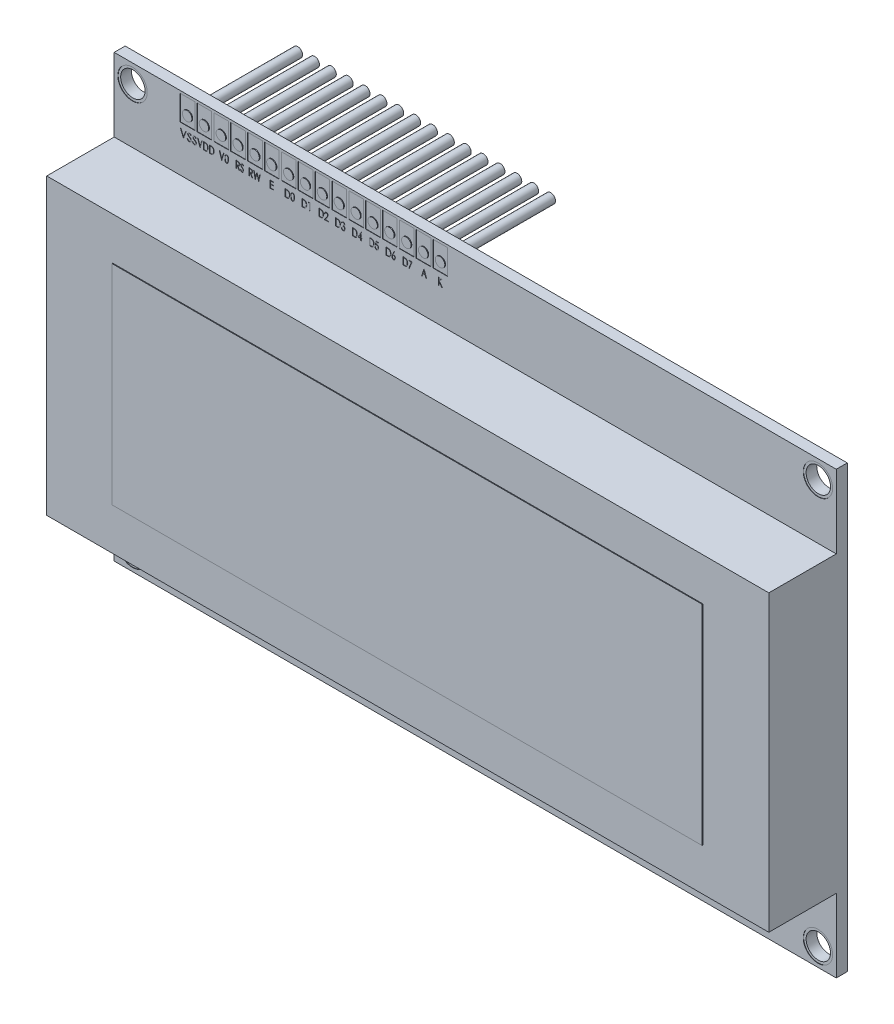
from build123d import *

# Parameters (mm, degrees)
SKETCH1_W                = 98.5
SKETCH1_H                = 60.1
SKETCH1_R                = 1.665
SKETCH1_R_2              = 0.65
BOSS_EXTRUDE1_DEPTH      = 0.75
SKETCH2_W                = 98.5
SKETCH2_H                = 40.1
BOSS_EXTRUDE2_DEPTH      = 9.2
SKETCH3_W                = 80.5
SKETCH3_H                = 28.5
BOSS_EXTRUDE3_DEPTH      = 0.1
SKETCH4_R                = 2.002768579
SKETCH4_W                = 2
SKETCH4_H                = 3.4
CUT_EXTRUDE1_DEPTH       = 0.05
CUT_EXTRUDE2_DEPTH       = 0.05
BOSS_EXTRUDE4_DEPTH      = 0.1
BOSS_EXTRUDE4_DEPTH_BACK = 15
SKETCH7_R                = 0.65


with BuildPart() as part:
    # Sketch1 → Boss-Extrude1 (new, symmetric)
    with BuildSketch(Plane.XY):
        Rectangle(SKETCH1_W, SKETCH1_H)
        with Locations((-46.75, 27.55)):
            Circle(SKETCH1_R, mode=Mode.SUBTRACT)
        with Locations((46.75, 27.55)):
            Circle(SKETCH1_R, mode=Mode.SUBTRACT)
        with Locations((-46.75, -27.55)):
            Circle(SKETCH1_R, mode=Mode.SUBTRACT)
        with Locations((46.75, -27.55)):
            Circle(SKETCH1_R, mode=Mode.SUBTRACT)
        with Locations((-39.25, 27.55)):
            Circle(SKETCH1_R_2, mode=Mode.SUBTRACT)
        with Locations((-36.95, 27.55)):
            Circle(SKETCH1_R_2, mode=Mode.SUBTRACT)
        with Locations((-34.65, 27.55)):
            Circle(SKETCH1_R_2, mode=Mode.SUBTRACT)
        with Locations((-32.35, 27.55)):
            Circle(SKETCH1_R_2, mode=Mode.SUBTRACT)
        with Locations((-30.05, 27.55)):
            Circle(SKETCH1_R_2, mode=Mode.SUBTRACT)
        with Locations((-27.75, 27.55)):
            Circle(SKETCH1_R_2, mode=Mode.SUBTRACT)
        with Locations((-25.45, 27.55)):
            Circle(SKETCH1_R_2, mode=Mode.SUBTRACT)
        with Locations((-23.15, 27.55)):
            Circle(SKETCH1_R_2, mode=Mode.SUBTRACT)
        with Locations((-20.85, 27.55)):
            Circle(SKETCH1_R_2, mode=Mode.SUBTRACT)
        with Locations((-18.55, 27.55)):
            Circle(SKETCH1_R_2, mode=Mode.SUBTRACT)
        with Locations((-16.25, 27.55)):
            Circle(SKETCH1_R_2, mode=Mode.SUBTRACT)
        with Locations((-13.95, 27.55)):
            Circle(SKETCH1_R_2, mode=Mode.SUBTRACT)
        with Locations((-11.65, 27.55)):
            Circle(SKETCH1_R_2, mode=Mode.SUBTRACT)
        with Locations((-9.35, 27.55)):
            Circle(SKETCH1_R_2, mode=Mode.SUBTRACT)
        with Locations((-7.05, 27.55)):
            Circle(SKETCH1_R_2, mode=Mode.SUBTRACT)
        with Locations((-4.75, 27.55)):
            Circle(SKETCH1_R_2, mode=Mode.SUBTRACT)
    extrude(amount=BOSS_EXTRUDE1_DEPTH, both=True)

    # Sketch2 → Boss-Extrude2 (add)
    with BuildSketch(Plane.XY.offset(0.75)):
        Rectangle(SKETCH2_W, SKETCH2_H)
    extrude(amount=BOSS_EXTRUDE2_DEPTH)

    # Sketch3 → Boss-Extrude3 (add)
    with BuildSketch(Plane.XY.offset(9.95)):
        Rectangle(SKETCH3_W, SKETCH3_H)
    extrude(amount=BOSS_EXTRUDE3_DEPTH)

    # Sketch4 → Cut-Extrude1 (cut)
    with BuildSketch(Plane.XY.offset(0.75)):
        with Locations((-46.75, 27.55)):
            Circle(SKETCH4_R)
        with Locations((46.75, 27.55)):
            Circle(SKETCH4_R)
        with Locations((46.75, -27.55)):
            Circle(SKETCH4_R)
        with Locations((-46.75, -27.55)):
            Circle(SKETCH4_R)
        with Locations((-36.95, 28.01685787)):
            Rectangle(SKETCH4_W, SKETCH4_H)
        with Locations((-39.25, 28.01685787)):
            Rectangle(SKETCH4_W, SKETCH4_H)
        with Locations((-34.65, 28.01685787)):
            Rectangle(SKETCH4_W, SKETCH4_H)
        with Locations((-32.35, 28.01685787)):
            Rectangle(SKETCH4_W, SKETCH4_H)
        with Locations((-30.05, 28.01685787)):
            Rectangle(SKETCH4_W, SKETCH4_H)
        with Locations((-27.75, 28.01685787)):
            Rectangle(SKETCH4_W, SKETCH4_H)
        with Locations((-25.45, 28.01685787)):
            Rectangle(SKETCH4_W, SKETCH4_H)
        with Locations((-23.15, 28.01685787)):
            Rectangle(SKETCH4_W, SKETCH4_H)
        with Locations((-20.85, 28.01685787)):
            Rectangle(SKETCH4_W, SKETCH4_H)
        with Locations((-18.55, 28.01685787)):
            Rectangle(SKETCH4_W, SKETCH4_H)
        with Locations((-16.25, 28.01685787)):
            Rectangle(SKETCH4_W, SKETCH4_H)
        with Locations((-13.95, 28.01685787)):
            Rectangle(SKETCH4_W, SKETCH4_H)
        with Locations((-11.65, 28.01685787)):
            Rectangle(SKETCH4_W, SKETCH4_H)
        with Locations((-9.35, 28.01685787)):
            Rectangle(SKETCH4_W, SKETCH4_H)
        with Locations((-7.05, 28.01685787)):
            Rectangle(SKETCH4_W, SKETCH4_H)
        with Locations((-4.75, 28.01685787)):
            Rectangle(SKETCH4_W, SKETCH4_H)
    extrude(amount=-CUT_EXTRUDE1_DEPTH, mode=Mode.SUBTRACT)

    # Sketch5 → Cut-Extrude2 (cut)
    # profile 1 of 31: a face of its own
    with BuildSketch(Plane.XY.offset(0.75)):
        Polygon((-40.222689776, 25.635587016), (-40.12653593, 25.635587016), (-39.793202597, 24.847526118), (-39.459869264, 25.635587016), (-39.363715417, 25.635587016), (-39.786792341, 24.635587016), (-39.799612853, 24.635587016), align=None)
    # profile 2 of 31: a face of its own
    with BuildSketch(Plane.XY.offset(0.75)):
        with BuildLine():
            Line((-39.286792341, 24.828495669), (-39.202257084, 24.879176759))
            add(Edge.make_bspline(
                [(-39.202257084, 24.879176759), (-39.194394731, 24.866015506), (-39.179330765, 24.840799054), (-39.154201805, 24.806725328), (-39.12816383, 24.777764712), (-39.101024021, 24.754085681), (-39.072948036, 24.735443142), (-39.043752592, 24.722242504), (-39.013536074, 24.714009369), (-38.992972125, 24.713009344), (-38.982705802, 24.712510093)],
                knots=[0, 0, 0, 0, 1.272034388, 2.437168799, 3.508375237, 4.49857839, 5.41946034, 6.295179144, 7.148887113, 8, 8, 8, 8], degree=3))
            add(Edge.make_bspline(
                [(-38.982705802, 24.712510093), (-38.973938128, 24.712754285), (-38.956556192, 24.713238396), (-38.93096698, 24.717890054), (-38.906115037, 24.725036376), (-38.882512569, 24.735270928), (-38.86048525, 24.747653353), (-38.841169052, 24.762609404), (-38.824470162, 24.779354034), (-38.810810415, 24.798034792), (-38.800330405, 24.818125406), (-38.792275528, 24.838747106), (-38.787805507, 24.86022384), (-38.787132149, 24.874683973), (-38.786792341, 24.881981246)],
                knots=[0, 0, 0, 0, 1.095163259, 2.171163733, 3.241058638, 4.321873601, 5.38011039, 6.391990106, 7.366004449, 8.327778327, 9.272591725, 10.192022065, 11.087607919, 12, 12, 12, 12], degree=3))
            add(Edge.make_bspline(
                [(-38.786792341, 24.881981246), (-38.787213572, 24.890307203), (-38.788069875, 24.907232657), (-38.79530744, 24.932203987), (-38.806692939, 24.95691615), (-38.817196552, 24.972202226), (-38.822649712, 24.980138298)],
                knots=[0, 0, 0, 0, 0.938893495, 1.908633276, 2.914225137, 4, 4, 4, 4], degree=3))
            add(Edge.make_bspline(
                [(-38.822649712, 24.980138298), (-38.827127031, 24.985865962), (-38.8365266, 24.997890475), (-38.85268589, 25.015789114), (-38.871647637, 25.03425152), (-38.892762938, 25.053982679), (-38.916800964, 25.074064906), (-38.943008825, 25.095455843), (-38.972055642, 25.117342008), (-38.992426926, 25.132019884), (-39.002938174, 25.139593426)],
                knots=[0, 0, 0, 0, 0.722233717, 1.516239348, 2.393582979, 3.351407094, 4.387010283, 5.505090956, 6.712668013, 8, 8, 8, 8], degree=3))
            add(Edge.make_bspline(
                [(-39.002938174, 25.139593426), (-39.013459316, 25.147087308), (-39.033574938, 25.16141504), (-39.061705961, 25.182679121), (-39.086861522, 25.202120227), (-39.108929812, 25.219921373), (-39.127901126, 25.236084975), (-39.143924957, 25.250455814), (-39.156593117, 25.263422546), (-39.163637568, 25.271834358), (-39.166800353, 25.275611054)],
                knots=[0, 0, 0, 0, 1.452282411, 2.77665338, 3.964542531, 5.026858415, 5.96415736, 6.766646006, 7.446254459, 8, 8, 8, 8], degree=3))
            add(Edge.make_bspline(
                [(-39.166800353, 25.275611054), (-39.171221081, 25.281497065), (-39.179915034, 25.293072694), (-39.191391035, 25.311165511), (-39.201145082, 25.329686444), (-39.208791463, 25.348685262), (-39.215230382, 25.367895242), (-39.21956122, 25.387567026), (-39.222273047, 25.407612346), (-39.222550758, 25.421101918), (-39.222689776, 25.427854644)],
                knots=[0, 0, 0, 0, 1.068054152, 2.10047183, 3.106115577, 4.101338837, 5.06977816, 6.043150881, 7.020423561, 8, 8, 8, 8], degree=3))
            add(Edge.make_bspline(
                [(-39.222689776, 25.427854644), (-39.22231686, 25.438434579), (-39.221578997, 25.459368312), (-39.215338849, 25.489948549), (-39.205489451, 25.519144668), (-39.191690911, 25.546667621), (-39.173903096, 25.571800758), (-39.153318532, 25.594833183), (-39.128800965, 25.614195635), (-39.101900215, 25.631113366), (-39.072455537, 25.644355059), (-39.041600994, 25.654343911), (-39.009287544, 25.660003698), (-38.987400934, 25.660815917), (-38.976295546, 25.661228041)],
                knots=[0, 0, 0, 0, 1.005424448, 1.989358655, 2.955360095, 3.929531133, 4.905563448, 5.876582895, 6.856512386, 7.866279853, 8.892233794, 9.918561126, 10.94386622, 12, 12, 12, 12], degree=3))
            add(Edge.make_bspline(
                [(-38.976295546, 25.661228041), (-38.964511517, 25.660821598), (-38.941076845, 25.660013312), (-38.906605641, 25.652985446), (-38.873416865, 25.641356682), (-38.846718789, 25.628159923), (-38.825823714, 25.614979519), (-38.809888648, 25.602973854), (-38.793740805, 25.589152395), (-38.777249932, 25.573478325), (-38.760695458, 25.555807824), (-38.743831614, 25.536261913), (-38.726618966, 25.51496004), (-38.715545863, 25.49975304), (-38.709869264, 25.491957208)],
                knots=[0, 0, 0, 0, 1.286793592, 2.559021753, 3.825965368, 5.121522368, 5.803751409, 6.523245864, 7.299691795, 8.125521123, 9.008227632, 9.944561021, 10.946284179, 12, 12, 12, 12], degree=3))
            Line((-38.709869264, 25.491957208), (-38.790999071, 25.43045881))
            add(Edge.make_bspline(
                [(-38.790999071, 25.43045881), (-38.795897909, 25.436769865), (-38.805331925, 25.44892348), (-38.819654636, 25.465943856), (-38.83315425, 25.481491422), (-38.846454364, 25.494995744), (-38.858852544, 25.507196353), (-38.870885985, 25.517641998), (-38.882381514, 25.526435025), (-38.89687206, 25.5358189), (-38.915077122, 25.545120758), (-38.937929847, 25.552991923), (-38.96181164, 25.557721941), (-38.978077249, 25.558347337), (-38.986311571, 25.558663939)],
                knots=[0, 0, 0, 0, 1.181633172, 2.275549214, 3.290209073, 4.226197932, 5.078386478, 5.862611352, 6.581680152, 7.217281963, 8.414376989, 9.595101626, 10.782541182, 12, 12, 12, 12], degree=3))
            add(Edge.make_bspline(
                [(-38.986311571, 25.558663939), (-38.996642006, 25.558317739), (-39.016563277, 25.557650125), (-39.044846202, 25.5503587), (-39.070301609, 25.538878169), (-39.09217377, 25.522788175), (-39.110384335, 25.503725034), (-39.123557323, 25.481788219), (-39.131485942, 25.457564675), (-39.13245345, 25.440667059), (-39.132946187, 25.432061375)],
                knots=[0, 0, 0, 0, 1.14458467, 2.207223713, 3.21896685, 4.227309161, 5.202851033, 6.127160689, 7.046193047, 8, 8, 8, 8], degree=3))
            add(Edge.make_bspline(
                [(-39.132946187, 25.432061375), (-39.132833865, 25.426703809), (-39.132609037, 25.415979918), (-39.129473381, 25.400136655), (-39.125445001, 25.384333415), (-39.119061392, 25.368641248), (-39.110248448, 25.352785717), (-39.098675541, 25.336493792), (-39.084100309, 25.319621875), (-39.072935448, 25.30864834), (-39.067040738, 25.302854644)],
                knots=[0, 0, 0, 0, 0.858281714, 1.717966888, 2.583508476, 3.4729293, 4.427298488, 5.488583878, 6.674047936, 8, 8, 8, 8], degree=3))
            add(Edge.make_bspline(
                [(-39.067040738, 25.302854644), (-39.064851774, 25.300901208), (-39.059651298, 25.296260291), (-39.050143891, 25.288662497), (-39.037588806, 25.279290276), (-39.022313891, 25.2676939), (-39.004037502, 25.254242054), (-38.982757629, 25.239106736), (-38.958711476, 25.221796605), (-38.941648072, 25.20969445), (-38.932625674, 25.203295349)],
                knots=[0, 0, 0, 0, 0.420754252, 0.999615792, 1.744751191, 2.668019286, 3.750313428, 4.999500688, 6.413464383, 8, 8, 8, 8], degree=3))
            add(Edge.make_bspline(
                [(-38.932625674, 25.203295349), (-38.921772556, 25.195397818), (-38.900756997, 25.180105343), (-38.870854831, 25.157129434), (-38.843742315, 25.134658643), (-38.819324256, 25.11283647), (-38.797359425, 25.091828443), (-38.778091505, 25.07138182), (-38.761324168, 25.051643085), (-38.743272963, 25.026336635), (-38.724827871, 24.995256325), (-38.708987441, 24.957176829), (-38.698999341, 24.918949308), (-38.697693194, 24.893255927), (-38.697048751, 24.880579003)],
                knots=[0, 0, 0, 0, 1.163667725, 2.253281268, 3.268753668, 4.215851969, 5.092017293, 5.902905408, 6.650798638, 7.335211899, 8.59617414, 9.77448103, 10.901945474, 12, 12, 12, 12], degree=3))
            add(Edge.make_bspline(
                [(-38.697048751, 24.880579003), (-38.697236505, 24.871613756), (-38.697608366, 24.85385736), (-38.701882913, 24.827784481), (-38.708145674, 24.802461376), (-38.717584884, 24.778201058), (-38.729105786, 24.754559697), (-38.743724714, 24.73215744), (-38.760669767, 24.710498469), (-38.780107986, 24.690160328), (-38.801378243, 24.671489987), (-38.823859299, 24.654881683), (-38.847587948, 24.641033591), (-38.872435467, 24.62973335), (-38.898407564, 24.620895202), (-38.925495502, 24.614491526), (-38.953743934, 24.610561322), (-38.972944071, 24.610153391), (-38.982705802, 24.60994599)],
                knots=[0, 0, 0, 0, 0.983748083, 1.948392443, 2.894712957, 3.844097841, 4.80183111, 5.778335162, 6.776009319, 7.81870978, 8.863265674, 9.881300176, 10.883814829, 11.87499822, 12.874611388, 13.892143829, 14.928324115, 16, 16, 16, 16], degree=3))
            add(Edge.make_bspline(
                [(-38.982705802, 24.60994599), (-38.990258757, 24.610092042), (-39.005269546, 24.610382306), (-39.027472255, 24.612948386), (-39.049226423, 24.616578987), (-39.070259075, 24.622343007), (-39.090841193, 24.629336429), (-39.11088326, 24.637947382), (-39.13039499, 24.648266582), (-39.149485728, 24.66006516), (-39.16810692, 24.673795945), (-39.186083911, 24.689788372), (-39.204006536, 24.707601374), (-39.221345792, 24.727718677), (-39.238452404, 24.749815273), (-39.254989093, 24.774097896), (-39.271298155, 24.800434283), (-39.281531146, 24.818967165), (-39.286792341, 24.828495669)],
                knots=[0, 0, 0, 0, 0.915332311, 1.819136955, 2.706846663, 3.586547465, 4.459518054, 5.340707479, 6.227863349, 7.133153174, 8.059268498, 9.028702269, 10.047606654, 11.120612155, 12.245963614, 13.433783089, 14.680604001, 16, 16, 16, 16], degree=3))
        make_face()
    # profile 3 of 31: a face of its own
    with BuildSketch(Plane.XY.offset(0.75)):
        with BuildLine():
            Line((-38.594484648, 24.828495669), (-38.509949392, 24.879176759))
            add(Edge.make_bspline(
                [(-38.509949392, 24.879176759), (-38.502087038, 24.866015506), (-38.487023072, 24.840799054), (-38.461894113, 24.806725328), (-38.435856138, 24.777764712), (-38.408716328, 24.754085681), (-38.380640343, 24.735443142), (-38.351444899, 24.722242504), (-38.321228382, 24.714009369), (-38.300664433, 24.713009344), (-38.29039811, 24.712510093)],
                knots=[0, 0, 0, 0, 1.272034388, 2.437168799, 3.508375237, 4.49857839, 5.41946034, 6.295179144, 7.148887113, 8, 8, 8, 8], degree=3))
            add(Edge.make_bspline(
                [(-38.29039811, 24.712510093), (-38.281630435, 24.712754285), (-38.2642485, 24.713238396), (-38.238659288, 24.717890054), (-38.213807344, 24.725036376), (-38.190204876, 24.735270928), (-38.168177558, 24.747653353), (-38.148861359, 24.762609404), (-38.13216247, 24.779354034), (-38.118502723, 24.798034792), (-38.108022713, 24.818125406), (-38.099967836, 24.838747106), (-38.095497815, 24.86022384), (-38.094824457, 24.874683973), (-38.094484648, 24.881981246)],
                knots=[0, 0, 0, 0, 1.095163259, 2.171163733, 3.241058638, 4.321873601, 5.38011039, 6.391990106, 7.366004449, 8.327778327, 9.272591725, 10.192022065, 11.087607919, 12, 12, 12, 12], degree=3))
            add(Edge.make_bspline(
                [(-38.094484648, 24.881981246), (-38.09490588, 24.890307203), (-38.095762182, 24.907232657), (-38.102999748, 24.932203987), (-38.114385247, 24.95691615), (-38.12488886, 24.972202226), (-38.13034202, 24.980138298)],
                knots=[0, 0, 0, 0, 0.938893495, 1.908633276, 2.914225137, 4, 4, 4, 4], degree=3))
            add(Edge.make_bspline(
                [(-38.13034202, 24.980138298), (-38.134819338, 24.985865962), (-38.144218908, 24.997890475), (-38.160378197, 25.015789114), (-38.179339944, 25.03425152), (-38.200455246, 25.053982679), (-38.224493271, 25.074064906), (-38.250701132, 25.095455843), (-38.279747949, 25.117342008), (-38.300119234, 25.132019884), (-38.310630482, 25.139593426)],
                knots=[0, 0, 0, 0, 0.722233717, 1.516239348, 2.393582979, 3.351407094, 4.387010283, 5.505090956, 6.712668013, 8, 8, 8, 8], degree=3))
            add(Edge.make_bspline(
                [(-38.310630482, 25.139593426), (-38.321151623, 25.147087308), (-38.341267245, 25.16141504), (-38.369398269, 25.182679121), (-38.39455383, 25.202120227), (-38.41662212, 25.219921373), (-38.435593433, 25.236084975), (-38.451617265, 25.250455814), (-38.464285424, 25.263422546), (-38.471329876, 25.271834358), (-38.474492661, 25.275611054)],
                knots=[0, 0, 0, 0, 1.452282411, 2.77665338, 3.964542531, 5.026858415, 5.96415736, 6.766646006, 7.446254459, 8, 8, 8, 8], degree=3))
            add(Edge.make_bspline(
                [(-38.474492661, 25.275611054), (-38.478913388, 25.281497065), (-38.487607342, 25.293072694), (-38.499083343, 25.311165511), (-38.50883739, 25.329686444), (-38.51648377, 25.348685262), (-38.52292269, 25.367895242), (-38.527253527, 25.387567026), (-38.529965355, 25.407612346), (-38.530243065, 25.421101918), (-38.530382084, 25.427854644)],
                knots=[0, 0, 0, 0, 1.068054152, 2.10047183, 3.106115577, 4.101338837, 5.06977816, 6.043150881, 7.020423561, 8, 8, 8, 8], degree=3))
            add(Edge.make_bspline(
                [(-38.530382084, 25.427854644), (-38.530009167, 25.438434579), (-38.529271304, 25.459368312), (-38.523031157, 25.489948549), (-38.513181758, 25.519144668), (-38.499383219, 25.546667621), (-38.481595404, 25.571800758), (-38.46101084, 25.594833183), (-38.436493272, 25.614195635), (-38.409592523, 25.631113366), (-38.380147845, 25.644355059), (-38.349293301, 25.654343911), (-38.316979852, 25.660003698), (-38.295093242, 25.660815917), (-38.283987853, 25.661228041)],
                knots=[0, 0, 0, 0, 1.005424448, 1.989358655, 2.955360095, 3.929531133, 4.905563448, 5.876582895, 6.856512386, 7.866279853, 8.892233794, 9.918561126, 10.94386622, 12, 12, 12, 12], degree=3))
            add(Edge.make_bspline(
                [(-38.283987853, 25.661228041), (-38.272203825, 25.660821598), (-38.248769153, 25.660013312), (-38.214297948, 25.652985446), (-38.181109172, 25.641356682), (-38.154411097, 25.628159923), (-38.133516022, 25.614979519), (-38.117580955, 25.602973854), (-38.101433112, 25.589152395), (-38.084942239, 25.573478325), (-38.068387765, 25.555807824), (-38.051523922, 25.536261913), (-38.034311274, 25.51496004), (-38.023238171, 25.49975304), (-38.017561571, 25.491957208)],
                knots=[0, 0, 0, 0, 1.286793592, 2.559021753, 3.825965368, 5.121522368, 5.803751409, 6.523245864, 7.299691795, 8.125521123, 9.008227632, 9.944561021, 10.946284179, 12, 12, 12, 12], degree=3))
            Line((-38.017561571, 25.491957208), (-38.098691379, 25.43045881))
            add(Edge.make_bspline(
                [(-38.098691379, 25.43045881), (-38.103590217, 25.436769865), (-38.113024233, 25.44892348), (-38.127346944, 25.465943856), (-38.140846557, 25.481491422), (-38.154146672, 25.494995744), (-38.166544852, 25.507196353), (-38.178578293, 25.517641998), (-38.190073822, 25.526435025), (-38.204564367, 25.5358189), (-38.22276943, 25.545120758), (-38.245622154, 25.552991923), (-38.269503947, 25.557721941), (-38.285769556, 25.558347337), (-38.294003879, 25.558663939)],
                knots=[0, 0, 0, 0, 1.181633172, 2.275549214, 3.290209073, 4.226197932, 5.078386478, 5.862611352, 6.581680152, 7.217281963, 8.414376989, 9.595101626, 10.782541182, 12, 12, 12, 12], degree=3))
            add(Edge.make_bspline(
                [(-38.294003879, 25.558663939), (-38.304334314, 25.558317739), (-38.324255585, 25.557650125), (-38.352538509, 25.5503587), (-38.377993916, 25.538878169), (-38.399866078, 25.522788175), (-38.418076643, 25.503725034), (-38.431249631, 25.481788219), (-38.439178249, 25.457564675), (-38.440145758, 25.440667059), (-38.440638494, 25.432061375)],
                knots=[0, 0, 0, 0, 1.14458467, 2.207223713, 3.21896685, 4.227309161, 5.202851033, 6.127160689, 7.046193047, 8, 8, 8, 8], degree=3))
            add(Edge.make_bspline(
                [(-38.440638494, 25.432061375), (-38.440526172, 25.426703809), (-38.440301345, 25.415979918), (-38.437165689, 25.400136655), (-38.433137309, 25.384333415), (-38.4267537, 25.368641248), (-38.417940756, 25.352785717), (-38.406367848, 25.336493792), (-38.391792616, 25.319621875), (-38.380627756, 25.30864834), (-38.374733046, 25.302854644)],
                knots=[0, 0, 0, 0, 0.858281714, 1.717966888, 2.583508476, 3.4729293, 4.427298488, 5.488583878, 6.674047936, 8, 8, 8, 8], degree=3))
            add(Edge.make_bspline(
                [(-38.374733046, 25.302854644), (-38.372544082, 25.300901208), (-38.367343606, 25.296260291), (-38.357836198, 25.288662497), (-38.345281113, 25.279290276), (-38.330006199, 25.2676939), (-38.31172981, 25.254242054), (-38.290449936, 25.239106736), (-38.266403784, 25.221796605), (-38.24934038, 25.20969445), (-38.240317982, 25.203295349)],
                knots=[0, 0, 0, 0, 0.420754252, 0.999615792, 1.744751191, 2.668019286, 3.750313428, 4.999500688, 6.413464383, 8, 8, 8, 8], degree=3))
            add(Edge.make_bspline(
                [(-38.240317982, 25.203295349), (-38.229464863, 25.195397818), (-38.208449305, 25.180105343), (-38.178547139, 25.157129434), (-38.151434622, 25.134658643), (-38.127016564, 25.11283647), (-38.105051733, 25.091828443), (-38.085783813, 25.07138182), (-38.069016476, 25.051643085), (-38.05096527, 25.026336635), (-38.032520179, 24.995256325), (-38.016679748, 24.957176829), (-38.006691649, 24.918949308), (-38.005385502, 24.893255927), (-38.004741058, 24.880579003)],
                knots=[0, 0, 0, 0, 1.163667725, 2.253281268, 3.268753668, 4.215851969, 5.092017293, 5.902905408, 6.650798638, 7.335211899, 8.59617414, 9.77448103, 10.901945474, 12, 12, 12, 12], degree=3))
            add(Edge.make_bspline(
                [(-38.004741058, 24.880579003), (-38.004928812, 24.871613756), (-38.005300674, 24.85385736), (-38.00957522, 24.827784481), (-38.015837982, 24.802461376), (-38.025277192, 24.778201058), (-38.036798094, 24.754559697), (-38.051417022, 24.73215744), (-38.068362075, 24.710498469), (-38.087800293, 24.690160328), (-38.109070551, 24.671489987), (-38.131551607, 24.654881683), (-38.155280256, 24.641033591), (-38.180127775, 24.62973335), (-38.206099871, 24.620895202), (-38.23318781, 24.614491526), (-38.261436241, 24.610561322), (-38.280636379, 24.610153391), (-38.29039811, 24.60994599)],
                knots=[0, 0, 0, 0, 0.983748083, 1.948392443, 2.894712957, 3.844097841, 4.80183111, 5.778335162, 6.776009319, 7.81870978, 8.863265674, 9.881300176, 10.883814829, 11.87499822, 12.874611388, 13.892143829, 14.928324115, 16, 16, 16, 16], degree=3))
            add(Edge.make_bspline(
                [(-38.29039811, 24.60994599), (-38.297951065, 24.610092042), (-38.312961853, 24.610382306), (-38.335164563, 24.612948386), (-38.356918731, 24.616578987), (-38.377951383, 24.622343007), (-38.398533501, 24.629336429), (-38.418575568, 24.637947382), (-38.438087297, 24.648266582), (-38.457178035, 24.66006516), (-38.475799228, 24.673795945), (-38.493776219, 24.689788372), (-38.511698843, 24.707601374), (-38.529038099, 24.727718677), (-38.546144712, 24.749815273), (-38.5626814, 24.774097896), (-38.578990463, 24.800434283), (-38.589223453, 24.818967165), (-38.594484648, 24.828495669)],
                knots=[0, 0, 0, 0, 0.915332311, 1.819136955, 2.706846663, 3.586547465, 4.459518054, 5.340707479, 6.227863349, 7.133153174, 8.059268498, 9.028702269, 10.047606654, 11.120612155, 12.245963614, 13.433783089, 14.680604001, 16, 16, 16, 16], degree=3))
        make_face()
    # profile 4 of 31: a face of its own
    with BuildSketch(Plane.XY.offset(0.75)):
        Polygon((-37.87653593, 25.635587016), (-37.792801956, 25.635587016), (-37.536792341, 24.86775849), (-37.280782725, 25.635587016), (-37.197048751, 25.635587016), (-37.530382084, 24.635587016), (-37.543202597, 24.635587016), align=None)
    # profile 5 of 31: a face of its own
    with BuildSketch(Plane.XY.offset(0.75)):
        with BuildLine():
            Line((-37.068843623, 24.635587016), (-37.068843623, 25.635587016))
            Line((-37.068843623, 25.635587016), (-36.907986251, 25.635587016))
            add(Edge.make_bspline(
                [(-36.907986251, 25.635587016), (-36.893962371, 25.635461102), (-36.866906693, 25.635218182), (-36.827818777, 25.63366598), (-36.791659912, 25.630921947), (-36.758518016, 25.626926699), (-36.728324477, 25.62204847), (-36.701164841, 25.615824511), (-36.67690696, 25.608661773), (-36.662147503, 25.602457456), (-36.655181764, 25.599529323)],
                knots=[0, 0, 0, 0, 1.309430673, 2.526229238, 3.651873232, 4.694326079, 5.642438365, 6.506035363, 7.294921946, 8, 8, 8, 8], degree=3))
            add(Edge.make_bspline(
                [(-36.655181764, 25.599529323), (-36.645945045, 25.595089535), (-36.62748516, 25.586216472), (-36.601428587, 25.569918646), (-36.577115004, 25.551084391), (-36.554066133, 25.530173884), (-36.532775267, 25.506760148), (-36.512933294, 25.481043813), (-36.494779898, 25.453002872), (-36.478218389, 25.422694603), (-36.463188621, 25.390643234), (-36.450426288, 25.356760346), (-36.439400049, 25.32152803), (-36.430304062, 25.284754951), (-36.423646204, 25.246374408), (-36.418613994, 25.206541435), (-36.415555079, 25.165215585), (-36.415185252, 25.137194728), (-36.414997469, 25.122966823)],
                knots=[0, 0, 0, 0, 0.871518369, 1.741757969, 2.608820314, 3.485545573, 4.386350893, 5.297754603, 6.246434625, 7.225407549, 8.23451574, 9.255928451, 10.303566895, 11.374260915, 12.476493082, 13.616005354, 14.789499959, 16, 16, 16, 16], degree=3))
            add(Edge.make_bspline(
                [(-36.414997469, 25.122966823), (-36.415139604, 25.1106089), (-36.415419541, 25.086269811), (-36.417981721, 25.050390593), (-36.421597513, 25.01558921), (-36.427354376, 24.982002313), (-36.434210685, 24.949370924), (-36.443144464, 24.918002691), (-36.453254054, 24.88764167), (-36.465154344, 24.858694348), (-36.477987214, 24.831135468), (-36.492208511, 24.805459996), (-36.506745736, 24.78128255), (-36.52305133, 24.759456432), (-36.539731947, 24.739171489), (-36.557474162, 24.720728858), (-36.576350104, 24.704390835), (-36.596131853, 24.689453614), (-36.617549987, 24.676590163), (-36.64079591, 24.665447117), (-36.666093731, 24.656391874), (-36.693329498, 24.648732101), (-36.722580062, 24.642737013), (-36.75391541, 24.638673156), (-36.787211699, 24.635953262), (-36.810090526, 24.635711343), (-36.82184843, 24.635587016)],
                knots=[0, 0, 0, 0, 1.23098154, 2.424433871, 3.582218973, 4.715238027, 5.817791712, 6.902459275, 7.962719028, 9.004111742, 10.018880715, 10.989401734, 11.927272101, 12.826724728, 13.70062318, 14.54274969, 15.372568198, 16.185495768, 17.009212192, 17.85723006, 18.749544748, 19.682518575, 20.674060891, 21.721195903, 22.828875351, 24, 24, 24, 24], degree=3))
            Line((-36.82184843, 24.635587016), (-37.068843623, 24.635587016))
        make_face()
        with BuildLine():
            Line((-36.991920546, 24.738151118), (-36.902377276, 24.738151118))
            add(Edge.make_bspline(
                [(-36.902377276, 24.738151118), (-36.889488988, 24.738221068), (-36.864774717, 24.738355202), (-36.829238185, 24.73955738), (-36.79676979, 24.74151578), (-36.767294682, 24.744248047), (-36.740905188, 24.747858572), (-36.717521932, 24.751929802), (-36.697235659, 24.756947354), (-36.685063552, 24.761487162), (-36.679420546, 24.763591823)],
                knots=[0, 0, 0, 0, 1.371756857, 2.630447951, 3.784000471, 4.833481419, 5.780309705, 6.618141895, 7.359368634, 8, 8, 8, 8], degree=3))
            add(Edge.make_bspline(
                [(-36.679420546, 24.763591823), (-36.672282974, 24.766809621), (-36.658105143, 24.773201345), (-36.637871553, 24.784949516), (-36.618936189, 24.798625662), (-36.600894263, 24.813821557), (-36.584482177, 24.831277359), (-36.569106005, 24.85035275), (-36.554480428, 24.870992933), (-36.541656351, 24.893741011), (-36.529757782, 24.917787041), (-36.519845563, 24.943402683), (-36.511196402, 24.970148079), (-36.503905528, 24.998206582), (-36.498595336, 25.027684879), (-36.494874582, 25.058390115), (-36.49234135, 25.090339316), (-36.492062696, 25.112077698), (-36.491920546, 25.123167144)],
                knots=[0, 0, 0, 0, 0.872846556, 1.733792719, 2.6038707, 3.475477258, 4.360440251, 5.271163554, 6.207086466, 7.177944141, 8.180505183, 9.196993831, 10.237986842, 11.314549574, 12.427638609, 13.575851325, 14.763363968, 16, 16, 16, 16], degree=3))
            add(Edge.make_bspline(
                [(-36.491920546, 25.123167144), (-36.492048284, 25.134858194), (-36.492298986, 25.157803264), (-36.49503957, 25.191495607), (-36.499129051, 25.223888872), (-36.505203484, 25.254973987), (-36.512759532, 25.284825648), (-36.521983366, 25.313427417), (-36.532954886, 25.340713314), (-36.545826205, 25.366480127), (-36.559924655, 25.390749972), (-36.575598594, 25.413021348), (-36.592528002, 25.433400351), (-36.610677455, 25.451946217), (-36.630523746, 25.46813749), (-36.651332892, 25.48274342), (-36.673765515, 25.495029477), (-36.689507701, 25.501642083), (-36.697449392, 25.504978041)],
                knots=[0, 0, 0, 0, 1.215863483, 2.386276084, 3.514051247, 4.610658038, 5.67873613, 6.715526467, 7.734503913, 8.734748735, 9.709217586, 10.65154377, 11.564008312, 12.462834927, 13.345957941, 14.22456227, 15.104319012, 16, 16, 16, 16], degree=3))
            add(Edge.make_bspline(
                [(-36.697449392, 25.504978041), (-36.703957832, 25.507298317), (-36.717793587, 25.5122308), (-36.740525524, 25.517549933), (-36.76605257, 25.522372477), (-36.794526562, 25.526359994), (-36.826016611, 25.529251595), (-36.86041991, 25.531406137), (-36.897757315, 25.532873136), (-36.923609743, 25.532971724), (-36.937032725, 25.533022913)],
                knots=[0, 0, 0, 0, 0.683862343, 1.453766431, 2.308522409, 3.256881265, 4.299899069, 5.439712276, 6.670658809, 8, 8, 8, 8], degree=3))
            Line((-36.937032725, 25.533022913), (-36.991920546, 25.533022913))
            Line((-36.991920546, 25.533022913), (-36.991920546, 24.738151118))
        make_face(mode=Mode.SUBTRACT)
    # profile 6 of 31: a face of its own
    with BuildSketch(Plane.XY.offset(0.75)):
        with BuildLine():
            Line((-36.261151315, 24.635587016), (-36.261151315, 25.635587016))
            Line((-36.261151315, 25.635587016), (-36.100293943, 25.635587016))
            add(Edge.make_bspline(
                [(-36.100293943, 25.635587016), (-36.086270064, 25.635461102), (-36.059214386, 25.635218182), (-36.020126469, 25.63366598), (-35.983967604, 25.630921947), (-35.950825708, 25.626926699), (-35.920632169, 25.62204847), (-35.893472534, 25.615824511), (-35.869214652, 25.608661773), (-35.854455196, 25.602457456), (-35.847489456, 25.599529323)],
                knots=[0, 0, 0, 0, 1.309430673, 2.526229238, 3.651873232, 4.694326079, 5.642438365, 6.506035363, 7.294921946, 8, 8, 8, 8], degree=3))
            add(Edge.make_bspline(
                [(-35.847489456, 25.599529323), (-35.838252737, 25.595089535), (-35.819792853, 25.586216472), (-35.793736279, 25.569918646), (-35.769422697, 25.551084391), (-35.746373825, 25.530173884), (-35.725082959, 25.506760148), (-35.705240987, 25.481043813), (-35.68708759, 25.453002872), (-35.670526081, 25.422694603), (-35.655496313, 25.390643234), (-35.642733981, 25.356760346), (-35.631707741, 25.32152803), (-35.622611754, 25.284754951), (-35.615953897, 25.246374408), (-35.610921686, 25.206541435), (-35.607862771, 25.165215585), (-35.607492945, 25.137194728), (-35.607305161, 25.122966823)],
                knots=[0, 0, 0, 0, 0.871518369, 1.741757969, 2.608820314, 3.485545573, 4.386350893, 5.297754603, 6.246434625, 7.225407549, 8.23451574, 9.255928451, 10.303566895, 11.374260915, 12.476493082, 13.616005354, 14.789499959, 16, 16, 16, 16], degree=3))
            add(Edge.make_bspline(
                [(-35.607305161, 25.122966823), (-35.607447296, 25.1106089), (-35.607727233, 25.086269811), (-35.610289414, 25.050390593), (-35.613905205, 25.01558921), (-35.619662068, 24.982002313), (-35.626518377, 24.949370924), (-35.635452156, 24.918002691), (-35.645561746, 24.88764167), (-35.657462036, 24.858694348), (-35.670294906, 24.831135468), (-35.684516203, 24.805459996), (-35.699053428, 24.78128255), (-35.715359022, 24.759456432), (-35.732039639, 24.739171489), (-35.749781855, 24.720728858), (-35.768657796, 24.704390835), (-35.788439546, 24.689453614), (-35.80985768, 24.676590163), (-35.833103602, 24.665447117), (-35.858401424, 24.656391874), (-35.88563719, 24.648732101), (-35.914887754, 24.642737013), (-35.946223102, 24.638673156), (-35.979519391, 24.635953262), (-36.002398219, 24.635711343), (-36.014156123, 24.635587016)],
                knots=[0, 0, 0, 0, 1.23098154, 2.424433871, 3.582218973, 4.715238027, 5.817791712, 6.902459275, 7.962719028, 9.004111742, 10.018880715, 10.989401734, 11.927272101, 12.826724728, 13.70062318, 14.54274969, 15.372568198, 16.185495768, 17.009212192, 17.85723006, 18.749544748, 19.682518575, 20.674060891, 21.721195903, 22.828875351, 24, 24, 24, 24], degree=3))
            Line((-36.014156123, 24.635587016), (-36.261151315, 24.635587016))
        make_face()
        with BuildLine():
            Line((-36.184228238, 24.738151118), (-36.094684969, 24.738151118))
            add(Edge.make_bspline(
                [(-36.094684969, 24.738151118), (-36.081796681, 24.738221068), (-36.057082409, 24.738355202), (-36.021545878, 24.73955738), (-35.989077483, 24.74151578), (-35.959602375, 24.744248047), (-35.933212881, 24.747858572), (-35.909829625, 24.751929802), (-35.889543351, 24.756947354), (-35.877371244, 24.761487162), (-35.871728238, 24.763591823)],
                knots=[0, 0, 0, 0, 1.371756857, 2.630447951, 3.784000471, 4.833481419, 5.780309705, 6.618141895, 7.359368634, 8, 8, 8, 8], degree=3))
            add(Edge.make_bspline(
                [(-35.871728238, 24.763591823), (-35.864590666, 24.766809621), (-35.850412836, 24.773201345), (-35.830179245, 24.784949516), (-35.811243882, 24.798625662), (-35.793201955, 24.813821557), (-35.776789869, 24.831277359), (-35.761413697, 24.85035275), (-35.74678812, 24.870992933), (-35.733964043, 24.893741011), (-35.722065474, 24.917787041), (-35.712153255, 24.943402683), (-35.703504094, 24.970148079), (-35.69621322, 24.998206582), (-35.690903029, 25.027684879), (-35.687182274, 25.058390115), (-35.684649042, 25.090339316), (-35.684370388, 25.112077698), (-35.684228238, 25.123167144)],
                knots=[0, 0, 0, 0, 0.872846556, 1.733792719, 2.6038707, 3.475477258, 4.360440251, 5.271163554, 6.207086466, 7.177944141, 8.180505183, 9.196993831, 10.237986842, 11.314549574, 12.427638609, 13.575851325, 14.763363968, 16, 16, 16, 16], degree=3))
            add(Edge.make_bspline(
                [(-35.684228238, 25.123167144), (-35.684355977, 25.134858194), (-35.684606679, 25.157803264), (-35.687347262, 25.191495607), (-35.691436743, 25.223888872), (-35.697511177, 25.254973987), (-35.705067224, 25.284825648), (-35.714291058, 25.313427417), (-35.725262578, 25.340713314), (-35.738133897, 25.366480127), (-35.752232348, 25.390749972), (-35.767906286, 25.413021348), (-35.784835694, 25.433400351), (-35.802985147, 25.451946217), (-35.822831439, 25.46813749), (-35.843640584, 25.48274342), (-35.866073208, 25.495029477), (-35.881815394, 25.501642083), (-35.889757084, 25.504978041)],
                knots=[0, 0, 0, 0, 1.215863483, 2.386276084, 3.514051247, 4.610658038, 5.67873613, 6.715526467, 7.734503913, 8.734748735, 9.709217586, 10.65154377, 11.564008312, 12.462834927, 13.345957941, 14.22456227, 15.104319012, 16, 16, 16, 16], degree=3))
            add(Edge.make_bspline(
                [(-35.889757084, 25.504978041), (-35.896265524, 25.507298317), (-35.910101279, 25.5122308), (-35.932833216, 25.517549933), (-35.958360263, 25.522372477), (-35.986834255, 25.526359994), (-36.018324304, 25.529251595), (-36.052727602, 25.531406137), (-36.090065008, 25.532873136), (-36.115917435, 25.532971724), (-36.129340417, 25.533022913)],
                knots=[0, 0, 0, 0, 0.683862343, 1.453766431, 2.308522409, 3.256881265, 4.299899069, 5.439712276, 6.670658809, 8, 8, 8, 8], degree=3))
            Line((-36.129340417, 25.533022913), (-36.184228238, 25.533022913))
            Line((-36.184228238, 25.533022913), (-36.184228238, 24.738151118))
        make_face(mode=Mode.SUBTRACT)
    # profile 7 of 31: a face of its own
    with BuildSketch(Plane.XY.offset(0.75)):
        Polygon((-34.914997469, 25.635587016), (-34.831263494, 25.635587016), (-34.575253879, 24.86775849), (-34.319244264, 25.635587016), (-34.235510289, 25.635587016), (-34.568843623, 24.635587016), (-34.581664135, 24.635587016), align=None)
    # profile 8 of 31: a face of its own
    with BuildSketch(Plane.XY.offset(0.75)):
        with BuildLine():
            add(Edge.make_bspline(
                [(-34.158587212, 25.135186375), (-34.158439617, 25.151212633), (-34.158152982, 25.182336344), (-34.156865437, 25.227698522), (-34.154243805, 25.270247698), (-34.150685158, 25.3100013), (-34.146119445, 25.346890066), (-34.140558816, 25.380983094), (-34.13400402, 25.412282971), (-34.126386961, 25.440977341), (-34.117622497, 25.467384327), (-34.108358307, 25.492084755), (-34.097801201, 25.515011453), (-34.086681398, 25.536368863), (-34.074832647, 25.556187367), (-34.062084976, 25.574305556), (-34.048071508, 25.590464967), (-34.033807692, 25.605470064), (-34.01848447, 25.618316012), (-34.003067947, 25.629958408), (-33.986957556, 25.639637224), (-33.970306945, 25.647355997), (-33.953408121, 25.653717635), (-33.936014884, 25.658127409), (-33.918154292, 25.660815711), (-33.906059183, 25.66109002), (-33.89997343, 25.661228041)],
                knots=[0, 0, 0, 0, 1.781901398, 3.460532095, 5.044788518, 6.520804026, 7.897452363, 9.176538264, 10.360312765, 11.451616863, 12.475215169, 13.452762962, 14.382988646, 15.279574158, 16.128804228, 16.948678406, 17.738629264, 18.505137989, 19.247576026, 19.958810054, 20.651434701, 21.332261274, 21.996989992, 22.656014566, 23.323762819, 24, 24, 24, 24], degree=3))
            add(Edge.make_bspline(
                [(-33.89997343, 25.661228041), (-33.893821116, 25.661087682), (-33.881527379, 25.660807213), (-33.863337106, 25.658121992), (-33.845596755, 25.653755355), (-33.828444001, 25.647351269), (-33.811580975, 25.639653611), (-33.795271304, 25.629886269), (-33.779392826, 25.618419166), (-33.764036563, 25.605166458), (-33.749063248, 25.590321725), (-33.735131647, 25.573493517), (-33.722144913, 25.554885361), (-33.709567745, 25.534798563), (-33.698102153, 25.512756899), (-33.687223263, 25.489040221), (-33.677256106, 25.463540419), (-33.667985722, 25.436233762), (-33.659762556, 25.406812365), (-33.652607427, 25.375113885), (-33.646386877, 25.341040341), (-33.641421814, 25.304542371), (-33.637706056, 25.265575878), (-33.634880074, 25.22423061), (-33.633327182, 25.180470725), (-33.633075408, 25.150545419), (-33.632946187, 25.135186375)],
                knots=[0, 0, 0, 0, 0.680015622, 1.358827319, 2.028662734, 2.696786366, 3.380680169, 4.075961124, 4.795334018, 5.544232778, 6.317033788, 7.124480586, 7.956310745, 8.825174656, 9.743468946, 10.701748025, 11.709644056, 12.76982753, 13.889669025, 15.086322274, 16.362388274, 17.718987041, 19.158433838, 20.690516929, 22.301421041, 24, 24, 24, 24], degree=3))
            add(Edge.make_bspline(
                [(-33.632946187, 25.135186375), (-33.633068385, 25.119893651), (-33.633306446, 25.090100968), (-33.634955653, 25.046551833), (-33.637442055, 25.005389431), (-33.641222994, 24.966629941), (-33.646229476, 24.930352442), (-33.652243331, 24.896406888), (-33.659089376, 24.864796538), (-33.667381702, 24.835536234), (-33.676701728, 24.80847769), (-33.686420636, 24.783042958), (-33.697298048, 24.759414604), (-33.708836175, 24.737354199), (-33.721266972, 24.717062924), (-33.734530597, 24.698466819), (-33.748731237, 24.681713936), (-33.76355461, 24.666592984), (-33.779087569, 24.653326503), (-33.794971577, 24.641704221), (-33.811438901, 24.631976468), (-33.828238681, 24.623930296), (-33.845549448, 24.617656301), (-33.863352498, 24.61330853), (-33.881508824, 24.61030338), (-33.893818198, 24.610065127), (-33.89997343, 24.60994599)],
                knots=[0, 0, 0, 0, 1.693248669, 3.298720394, 4.82480384, 6.258640445, 7.609562187, 8.878591748, 10.075077288, 11.189162254, 12.243632055, 13.243172686, 14.20261538, 15.122024733, 15.998236071, 16.835364342, 17.64854462, 18.427529536, 19.177337665, 19.907907745, 20.604032963, 21.291903361, 21.967788968, 22.638437747, 23.319158652, 24, 24, 24, 24], degree=3))
            add(Edge.make_bspline(
                [(-33.89997343, 24.60994599), (-33.906059781, 24.610079392), (-33.918089971, 24.610343072), (-33.935941389, 24.613086156), (-33.953312267, 24.617463044), (-33.970244377, 24.623578119), (-33.986827231, 24.631085526), (-34.002642714, 24.640976054), (-34.018276337, 24.652086584), (-34.033368802, 24.665009539), (-34.0477667, 24.679569103), (-34.061239821, 24.696019594), (-34.074085213, 24.714051683), (-34.086027637, 24.733827369), (-34.097051737, 24.755304343), (-34.107570704, 24.778285758), (-34.116776358, 24.803227734), (-34.125807429, 24.829784852), (-34.133591912, 24.858689335), (-34.140412936, 24.89016602), (-34.145900592, 24.924422425), (-34.150413664, 24.961318474), (-34.15432266, 25.000912628), (-34.156842725, 25.043277147), (-34.158157164, 25.088369689), (-34.158441223, 25.119293471), (-34.158587212, 25.135186375)],
                knots=[0, 0, 0, 0, 0.677096952, 1.338339662, 2.005406211, 2.668443115, 3.340255766, 4.027397533, 4.741163398, 5.474065193, 6.236238345, 7.017634829, 7.838551399, 8.699067334, 9.586765462, 10.524942004, 11.510680007, 12.54497159, 13.646778121, 14.840882375, 16.128929706, 17.507328321, 18.978512682, 20.55736376, 22.230698808, 24, 24, 24, 24], degree=3))
        make_face()
        with BuildLine():
            add(Edge.make_bspline(
                [(-34.081664135, 25.135587016), (-34.081571372, 25.122231914), (-34.081391385, 25.096319205), (-34.080459875, 25.058645826), (-34.078622249, 25.02351859), (-34.076299777, 24.990910684), (-34.073132626, 24.960838537), (-34.069133026, 24.933250141), (-34.064582209, 24.908177887), (-34.059360699, 24.885431566), (-34.053330313, 24.864633183), (-34.046454699, 24.845351567), (-34.03910479, 24.827336148), (-34.031092429, 24.810564199), (-34.022239082, 24.795152929), (-34.012888501, 24.780905509), (-34.002808526, 24.767937618), (-33.988709484, 24.752877738), (-33.970322971, 24.736997111), (-33.946744495, 24.723056122), (-33.922420617, 24.71420389), (-33.905784927, 24.713070034), (-33.897569584, 24.712510093)],
                knots=[0, 0, 0, 0, 1.585253382, 3.075843952, 4.472619842, 5.760128673, 6.955753547, 8.06095077, 9.068316143, 9.979618947, 10.829906407, 11.637100979, 12.408357834, 13.138614022, 13.841518553, 14.516382118, 15.160087741, 15.788184859, 16.963380614, 18.029108162, 19.026697924, 20, 20, 20, 20], degree=3))
            add(Edge.make_bspline(
                [(-33.897569584, 24.712510093), (-33.889283152, 24.712977242), (-33.872564242, 24.713919773), (-33.848387644, 24.722840283), (-33.825010837, 24.736361288), (-33.806963043, 24.751944548), (-33.793136297, 24.766739435), (-33.783197243, 24.77953541), (-33.774095188, 24.793756074), (-33.765494318, 24.809221537), (-33.757342381, 24.82593342), (-33.750315086, 24.844168482), (-33.743602836, 24.863656386), (-33.739844738, 24.877217953), (-33.737914135, 24.884184772)],
                knots=[0, 0, 0, 0, 1.179950538, 2.380697451, 3.63736744, 5.024996919, 5.767521967, 6.528927784, 7.335999231, 8.177356486, 9.056327879, 9.989928685, 10.967390406, 12, 12, 12, 12], degree=3))
            add(Edge.make_bspline(
                [(-33.737914135, 24.884184772), (-33.735624574, 24.893112573), (-33.730966332, 24.911276687), (-33.725472168, 24.939453761), (-33.720685484, 24.968850443), (-33.716619181, 24.999569783), (-33.713701092, 25.031653464), (-33.711519713, 25.065117715), (-33.710036484, 25.09991664), (-33.709925616, 25.12356622), (-33.709869264, 25.135587016)],
                knots=[0, 0, 0, 0, 0.8718959, 1.773921478, 2.714952333, 3.689817886, 4.705117713, 5.762496763, 6.862704138, 8, 8, 8, 8], degree=3))
            add(Edge.make_bspline(
                [(-33.709869264, 25.135587016), (-33.709945153, 25.147607072), (-33.7100936, 25.171119238), (-33.711279673, 25.205522145), (-33.713365166, 25.238238809), (-33.715777964, 25.269333385), (-33.719529857, 25.298695709), (-33.723545295, 25.326478282), (-33.728895316, 25.352488929), (-33.734561925, 25.377001205), (-33.741255472, 25.399732848), (-33.748191835, 25.420996558), (-33.756015592, 25.440568568), (-33.764377024, 25.458664551), (-33.773434964, 25.475071786), (-33.78278446, 25.490084739), (-33.793031874, 25.503329315), (-33.807154824, 25.518446582), (-33.825545803, 25.534094783), (-33.848678527, 25.548415017), (-33.872963571, 25.556900504), (-33.889429686, 25.558080578), (-33.897569584, 25.558663939)],
                knots=[0, 0, 0, 0, 1.427519131, 2.792338422, 4.087386796, 5.320879155, 6.495321347, 7.602283647, 8.653622338, 9.64806089, 10.589215667, 11.466924906, 12.303360749, 13.090967005, 13.832724313, 14.527915986, 15.189360817, 15.817798831, 16.982454729, 18.045985158, 19.034047716, 20, 20, 20, 20], degree=3))
            add(Edge.make_bspline(
                [(-33.897569584, 25.558663939), (-33.905843823, 25.5580874), (-33.922509178, 25.55692618), (-33.947049695, 25.548415558), (-33.970366335, 25.534157365), (-33.988719438, 25.518513475), (-34.002666921, 25.503560412), (-34.012675469, 25.49066268), (-34.022074246, 25.476479251), (-34.030648168, 25.460948287), (-34.038721789, 25.444248154), (-34.046045305, 25.426219468), (-34.052946916, 25.406946002), (-34.058899354, 25.386112902), (-34.064459952, 25.363430727), (-34.068883598, 25.338382257), (-34.072989192, 25.310810297), (-34.076025283, 25.280652092), (-34.078687732, 25.247999937), (-34.08044779, 25.21279392), (-34.081395496, 25.175055529), (-34.08157278, 25.149009028), (-34.081664135, 25.135587016)],
                knots=[0, 0, 0, 0, 0.981108698, 1.976075909, 3.045759451, 4.209702925, 4.826555694, 5.470216713, 6.145033515, 6.843991151, 7.574196738, 8.345400151, 9.15253879, 10.002767331, 10.915831776, 11.923127346, 13.020405197, 14.223828133, 15.519757537, 16.90852172, 18.406931538, 20, 20, 20, 20], degree=3))
        make_face(mode=Mode.SUBTRACT)
    # profile 9 of 31: a face of its own
    with BuildSketch(Plane.XY.offset(0.75)):
        with BuildLine():
            Line((-32.620125674, 25.635587016), (-32.464877276, 25.635587016))
            add(Edge.make_bspline(
                [(-32.464877276, 25.635587016), (-32.454527469, 25.635543584), (-32.434693983, 25.635460354), (-32.406169602, 25.63497085), (-32.380270427, 25.63362721), (-32.356935353, 25.632441269), (-32.336317787, 25.63029574), (-32.318239475, 25.628270345), (-32.302772812, 25.625542734), (-32.293457073, 25.623087987), (-32.289196187, 25.621965221)],
                knots=[0, 0, 0, 0, 1.406291012, 2.694895705, 3.875596585, 4.929939196, 5.86881668, 6.691431991, 7.401479668, 8, 8, 8, 8], degree=3))
            add(Edge.make_bspline(
                [(-32.289196187, 25.621965221), (-32.283545825, 25.620139913), (-32.272233309, 25.616485488), (-32.256080341, 25.609031415), (-32.240733885, 25.60007294), (-32.226028382, 25.589952214), (-32.2124016, 25.577988353), (-32.199565604, 25.564649786), (-32.187220305, 25.550082379), (-32.176215815, 25.533831083), (-32.1658355, 25.516643822), (-32.157119337, 25.498210611), (-32.14971, 25.478834969), (-32.143378734, 25.458609646), (-32.138929989, 25.437314318), (-32.135509381, 25.41511864), (-32.133175338, 25.391979959), (-32.133023324, 25.376177722), (-32.132946187, 25.368159131)],
                knots=[0, 0, 0, 0, 0.890219086, 1.782296258, 2.662026138, 3.55410331, 4.45596999, 5.376940187, 6.329934089, 7.316405561, 8.318020235, 9.33962404, 10.370274173, 11.428642517, 12.515222745, 13.630246086, 14.797506457, 16, 16, 16, 16], degree=3))
            add(Edge.make_bspline(
                [(-32.132946187, 25.368159131), (-32.133254509, 25.354850016), (-32.133853961, 25.328973909), (-32.139595327, 25.291408024), (-32.148955157, 25.256285732), (-32.162122873, 25.223823826), (-32.178714142, 25.194496219), (-32.198466457, 25.168566901), (-32.221825127, 25.146772614), (-32.243829255, 25.131632048), (-32.263312371, 25.121910244), (-32.279152187, 25.115143285), (-32.296477199, 25.109935083), (-32.314962494, 25.105224098), (-32.334849461, 25.101679013), (-32.356049892, 25.099119711), (-32.378580833, 25.097486823), (-32.394027733, 25.097248247), (-32.401976635, 25.097125477)],
                knots=[0, 0, 0, 0, 1.463301985, 2.845009436, 4.168980889, 5.453965417, 6.687638921, 7.866010869, 9.024897383, 10.188268473, 10.789455717, 11.41836669, 12.080505235, 12.777114878, 13.516268487, 14.300753823, 15.125575917, 16, 16, 16, 16], degree=3))
            Line((-32.401976635, 25.097125477), (-32.120125674, 24.635587016))
            Line((-32.120125674, 24.635587016), (-32.218082405, 24.635587016))
            Line((-32.218082405, 24.635587016), (-32.499933366, 25.097125477))
            Line((-32.499933366, 25.097125477), (-32.543202597, 25.097125477))
            Line((-32.543202597, 25.097125477), (-32.543202597, 24.635587016))
            Line((-32.543202597, 24.635587016), (-32.620125674, 24.635587016))
            Line((-32.620125674, 24.635587016), (-32.620125674, 25.635587016))
        make_face()
        with BuildLine():
            Line((-32.543202597, 25.533022913), (-32.543202597, 25.19968958))
            Line((-32.543202597, 25.19968958), (-32.407184969, 25.198287336))
            add(Edge.make_bspline(
                [(-32.407184969, 25.198287336), (-32.394823546, 25.198503087), (-32.371783045, 25.198905225), (-32.339772648, 25.202153358), (-32.312854133, 25.207686496), (-32.290505871, 25.215958983), (-32.272098401, 25.227303659), (-32.255926604, 25.240877194), (-32.242125931, 25.257501462), (-32.230472239, 25.276613548), (-32.221539736, 25.297755824), (-32.214432379, 25.320160371), (-32.210782186, 25.343935073), (-32.210176631, 25.360136133), (-32.209869264, 25.368359452)],
                knots=[0, 0, 0, 0, 1.484503796, 2.766972155, 3.858711607, 4.777707686, 5.612610321, 6.443380992, 7.3028828, 8.195570234, 9.122302869, 10.053363384, 11.011928053, 12, 12, 12, 12], degree=3))
            add(Edge.make_bspline(
                [(-32.209869264, 25.368359452), (-32.210149613, 25.376388094), (-32.210702201, 25.39221309), (-32.214752106, 25.415391069), (-32.221616604, 25.437382298), (-32.231025461, 25.457946511), (-32.242409444, 25.476618629), (-32.255773941, 25.492768285), (-32.270908583, 25.505929585), (-32.285093305, 25.514573566), (-32.297728062, 25.519862879), (-32.308616678, 25.523510918), (-32.32102853, 25.526439641), (-32.334893878, 25.528759621), (-32.350118435, 25.530807652), (-32.366766256, 25.532153126), (-32.384874186, 25.532967453), (-32.397435074, 25.533003915), (-32.403979841, 25.533022913)],
                knots=[0, 0, 0, 0, 1.313944225, 2.589872584, 3.837965354, 5.075530782, 6.282894025, 7.408145269, 8.493011398, 9.552186356, 10.110521641, 10.732722405, 11.429993849, 12.195550865, 13.033463864, 13.943953869, 14.928710818, 16, 16, 16, 16], degree=3))
            Line((-32.403979841, 25.533022913), (-32.543202597, 25.533022913))
        make_face(mode=Mode.SUBTRACT)
    # profile 10 of 31: a face of its own
    with BuildSketch(Plane.XY.offset(0.75)):
        with BuildLine():
            Line((-32.043202597, 24.828495669), (-31.977497469, 24.879176759))
            add(Edge.make_bspline(
                [(-31.977497469, 24.879176759), (-31.971477497, 24.866061781), (-31.960041625, 24.84114784), (-31.940812455, 24.807093535), (-31.920859335, 24.778161758), (-31.900018005, 24.754459919), (-31.878483382, 24.735809995), (-31.856120413, 24.722415625), (-31.83277939, 24.714023532), (-31.816771988, 24.713012074), (-31.808827597, 24.712510093)],
                knots=[0, 0, 0, 0, 1.383911973, 2.628955942, 3.746738872, 4.749501891, 5.649278085, 6.467738257, 7.239546467, 8, 8, 8, 8], degree=3))
            add(Edge.make_bspline(
                [(-31.808827597, 24.712510093), (-31.802125188, 24.712762958), (-31.788707375, 24.71326918), (-31.769011942, 24.717902739), (-31.749889877, 24.725156034), (-31.731830746, 24.735413491), (-31.714953876, 24.747955423), (-31.70012886, 24.76286891), (-31.687315306, 24.779665817), (-31.676981995, 24.798359737), (-31.668896879, 24.81831411), (-31.662758234, 24.838945346), (-31.65931806, 24.860298119), (-31.658832927, 24.87469126), (-31.658587212, 24.881981246)],
                knots=[0, 0, 0, 0, 0.957025484, 1.915906269, 2.876875915, 3.872777538, 4.875201359, 5.874300986, 6.869103784, 7.886329657, 8.918145261, 9.94233607, 10.957813246, 12, 12, 12, 12], degree=3))
            add(Edge.make_bspline(
                [(-31.658587212, 24.881981246), (-31.658976506, 24.890283296), (-31.659761886, 24.907032224), (-31.664857069, 24.931947488), (-31.673617783, 24.956569418), (-31.681824342, 24.972150994), (-31.686031123, 24.980138298)],
                knots=[0, 0, 0, 0, 0.966966069, 1.9508009, 2.949555883, 4, 4, 4, 4], degree=3))
            add(Edge.make_bspline(
                [(-31.686031123, 24.980138298), (-31.689447507, 24.985848811), (-31.696563261, 24.997742851), (-31.708850025, 25.015668345), (-31.723435792, 25.034162507), (-31.739509764, 25.053865256), (-31.757958047, 25.073997012), (-31.777912491, 25.095377163), (-31.800182492, 25.117265619), (-31.815812238, 25.132009623), (-31.823851635, 25.139593426)],
                knots=[0, 0, 0, 0, 0.755051921, 1.572646229, 2.463860742, 3.427272442, 4.457417882, 5.561650114, 6.745797563, 8, 8, 8, 8], degree=3))
            add(Edge.make_bspline(
                [(-31.823851635, 25.139593426), (-31.831902449, 25.14709912), (-31.847344559, 25.161495648), (-31.868852112, 25.182734123), (-31.888171376, 25.202148361), (-31.905061009, 25.219934419), (-31.919399007, 25.236234356), (-31.931848139, 25.250511175), (-31.941443877, 25.263559681), (-31.946815091, 25.271849537), (-31.949252276, 25.275611054)],
                knots=[0, 0, 0, 0, 1.424520873, 2.732346164, 3.911797783, 4.969453705, 5.906063081, 6.721610001, 7.419931359, 8, 8, 8, 8], degree=3))
            add(Edge.make_bspline(
                [(-31.949252276, 25.275611054), (-31.955814634, 25.287399413), (-31.968839239, 25.310796296), (-31.982060856, 25.348605752), (-31.990536315, 25.38774528), (-31.991455814, 25.414388618), (-31.991920546, 25.427854644)],
                knots=[0, 0, 0, 0, 1.010002809, 2.004597808, 2.991487604, 4, 4, 4, 4], degree=3))
            add(Edge.make_bspline(
                [(-31.991920546, 25.427854644), (-31.991606806, 25.438421938), (-31.990988197, 25.459257806), (-31.986275539, 25.489747254), (-31.978702561, 25.518873911), (-31.967927673, 25.546249933), (-31.954270522, 25.571479119), (-31.938390461, 25.59439236), (-31.919357014, 25.613950519), (-31.898481789, 25.630853398), (-31.875597431, 25.644198795), (-31.851698495, 25.654271152), (-31.826587812, 25.659988682), (-31.809589272, 25.660812501), (-31.801015097, 25.661228041)],
                knots=[0, 0, 0, 0, 1.134028395, 2.235999694, 3.303558056, 4.359136636, 5.385468439, 6.377922891, 7.341187669, 8.305065693, 9.252924554, 10.175426404, 11.07967301, 12, 12, 12, 12], degree=3))
            add(Edge.make_bspline(
                [(-31.801015097, 25.661228041), (-31.791824852, 25.660824665), (-31.773520083, 25.660021237), (-31.746666094, 25.652864332), (-31.720959577, 25.641172984), (-31.700380338, 25.628009954), (-31.684371913, 25.61479685), (-31.671873652, 25.602983049), (-31.65957644, 25.588950402), (-31.646629933, 25.573436695), (-31.633980833, 25.555620939), (-31.620629338, 25.536285575), (-31.607518012, 25.51478187), (-31.598920057, 25.499724712), (-31.594484648, 25.491957208)],
                knots=[0, 0, 0, 0, 1.175486554, 2.34128787, 3.531861235, 4.78213163, 5.45670903, 6.188699625, 6.982072091, 7.845002107, 8.775633155, 9.779069424, 10.854293392, 12, 12, 12, 12], degree=3))
            Line((-31.594484648, 25.491957208), (-31.65758561, 25.43045881))
            add(Edge.make_bspline(
                [(-31.65758561, 25.43045881), (-31.661200326, 25.436770646), (-31.668157409, 25.448918752), (-31.679105661, 25.465857168), (-31.689209198, 25.481340293), (-31.699047819, 25.49508573), (-31.708669199, 25.507013588), (-31.717663968, 25.517520575), (-31.726189725, 25.526409887), (-31.737108422, 25.535669603), (-31.75077592, 25.544923138), (-31.768067504, 25.552928345), (-31.786137859, 25.557694802), (-31.798450436, 25.558340399), (-31.804620866, 25.558663939)],
                knots=[0, 0, 0, 0, 1.277082512, 2.457943285, 3.540954167, 4.523791102, 5.424804978, 6.231190945, 6.952616042, 7.584745617, 8.7425584, 9.83919577, 10.917116091, 12, 12, 12, 12], degree=3))
            add(Edge.make_bspline(
                [(-31.804620866, 25.558663939), (-31.812426758, 25.558305957), (-31.827647265, 25.557607937), (-31.849159376, 25.550218269), (-31.868367318, 25.538445064), (-31.884784541, 25.522378442), (-31.898231725, 25.503130118), (-31.907937653, 25.481306254), (-31.913890932, 25.457347609), (-31.914621916, 25.440643385), (-31.914997469, 25.432061375)],
                knots=[0, 0, 0, 0, 0.99611477, 1.942298585, 2.874789164, 3.86028234, 4.861081634, 5.863631982, 6.902413458, 8, 8, 8, 8], degree=3))
            add(Edge.make_bspline(
                [(-31.914997469, 25.432061375), (-31.91441132, 25.421403219), (-31.913237324, 25.400055996), (-31.906444304, 25.373680144), (-31.897585028, 25.353011185), (-31.888934957, 25.336646285), (-31.877762087, 25.319815205), (-31.869195605, 25.308677482), (-31.86471702, 25.302854644)],
                knots=[0, 0, 0, 0, 1.355548403, 2.715028404, 3.434297335, 4.213120542, 5.065813534, 6, 6, 6, 6], degree=3))
            add(Edge.make_bspline(
                [(-31.86471702, 25.302854644), (-31.863072289, 25.300895739), (-31.859149247, 25.296223325), (-31.851645345, 25.288813016), (-31.84214057, 25.279224707), (-31.830418027, 25.267775089), (-31.816587056, 25.254222931), (-31.80027427, 25.239092185), (-31.781871482, 25.221836718), (-31.768834402, 25.209701234), (-31.761952597, 25.203295349)],
                knots=[0, 0, 0, 0, 0.428692003, 1.022523547, 1.766726267, 2.693054975, 3.769890224, 5.013497286, 6.423532597, 8, 8, 8, 8], degree=3))
            add(Edge.make_bspline(
                [(-31.761952597, 25.203295349), (-31.753637046, 25.195386581), (-31.737486612, 25.180026201), (-31.714561029, 25.157049531), (-31.693919229, 25.1344753), (-31.675064654, 25.112815933), (-31.658390991, 25.09161793), (-31.643465216, 25.071316963), (-31.630798682, 25.051413225), (-31.616834054, 25.02608859), (-31.60280264, 24.994757681), (-31.59064648, 24.956821819), (-31.583081412, 24.918740479), (-31.582134065, 24.893232292), (-31.581664135, 24.880579003)],
                knots=[0, 0, 0, 0, 1.084434174, 2.106184132, 3.066299982, 3.974504037, 4.819036384, 5.614179407, 6.354614465, 7.046545079, 8.345825613, 9.591028967, 10.805034351, 12, 12, 12, 12], degree=3))
            add(Edge.make_bspline(
                [(-31.581664135, 24.880579003), (-31.581859003, 24.871624302), (-31.582244044, 24.853930648), (-31.585227191, 24.827833259), (-31.590581568, 24.802700037), (-31.597478228, 24.778294987), (-31.606766316, 24.754861886), (-31.617999465, 24.732323699), (-31.631351672, 24.710792711), (-31.646370617, 24.690378989), (-31.662876285, 24.671622329), (-31.680495669, 24.655054918), (-31.699170807, 24.641231208), (-31.718621879, 24.629810972), (-31.739004041, 24.620944088), (-31.760301021, 24.614516975), (-31.782506005, 24.610573359), (-31.797593557, 24.610156669), (-31.805221828, 24.60994599)],
                knots=[0, 0, 0, 0, 1.104469644, 2.182329142, 3.233937398, 4.27141944, 5.306905159, 6.338287977, 7.373773695, 8.428087969, 9.460949709, 10.451670126, 11.405478766, 12.320888455, 13.22829632, 14.140290566, 15.059730392, 16, 16, 16, 16], degree=3))
            add(Edge.make_bspline(
                [(-31.805221828, 24.60994599), (-31.811107277, 24.610094826), (-31.822860326, 24.610392047), (-31.840200105, 24.612942209), (-31.857239975, 24.616608768), (-31.873694748, 24.622444703), (-31.889945321, 24.629311926), (-31.905656272, 24.638063304), (-31.920923725, 24.648325839), (-31.935828455, 24.660214093), (-31.950407191, 24.673982446), (-31.964524317, 24.689907138), (-31.978678571, 24.707672514), (-31.991906591, 24.727957915), (-32.005489695, 24.749912567), (-32.018329466, 24.774255083), (-32.031299969, 24.800484982), (-32.039155411, 24.818971348), (-32.043202597, 24.828495669)],
                knots=[0, 0, 0, 0, 0.820449022, 1.638409663, 2.440521417, 3.24753877, 4.069361106, 4.898905185, 5.751347498, 6.632806319, 7.555188638, 8.544456245, 9.599041491, 10.720130119, 11.919714617, 13.198980023, 14.556892339, 16, 16, 16, 16], degree=3))
        make_face()
    # profile 11 of 31: a face of its own
    with BuildSketch(Plane.XY.offset(0.75)):
        with BuildLine():
            Line((-30.838074392, 25.635587016), (-30.682825994, 25.635587016))
            add(Edge.make_bspline(
                [(-30.682825994, 25.635587016), (-30.672476187, 25.635543584), (-30.652642701, 25.635460354), (-30.62411832, 25.63497085), (-30.598219145, 25.63362721), (-30.574884071, 25.632441269), (-30.554266505, 25.63029574), (-30.536188193, 25.628270345), (-30.52072153, 25.625542734), (-30.511405791, 25.623087987), (-30.507144905, 25.621965221)],
                knots=[0, 0, 0, 0, 1.406291012, 2.694895705, 3.875596585, 4.929939196, 5.86881668, 6.691431991, 7.401479668, 8, 8, 8, 8], degree=3))
            add(Edge.make_bspline(
                [(-30.507144905, 25.621965221), (-30.501494543, 25.620139913), (-30.490182027, 25.616485488), (-30.474029059, 25.609031415), (-30.458682603, 25.60007294), (-30.4439771, 25.589952214), (-30.430350318, 25.577988353), (-30.417514322, 25.564649786), (-30.405169023, 25.550082379), (-30.394164533, 25.533831083), (-30.383784217, 25.516643822), (-30.375068055, 25.498210611), (-30.367658718, 25.478834969), (-30.361327452, 25.458609646), (-30.356878707, 25.437314318), (-30.353458099, 25.41511864), (-30.351124056, 25.391979959), (-30.350972042, 25.376177722), (-30.350894905, 25.368159131)],
                knots=[0, 0, 0, 0, 0.890219086, 1.782296258, 2.662026138, 3.55410331, 4.45596999, 5.376940187, 6.329934089, 7.316405561, 8.318020235, 9.33962404, 10.370274173, 11.428642517, 12.515222745, 13.630246086, 14.797506457, 16, 16, 16, 16], degree=3))
            add(Edge.make_bspline(
                [(-30.350894905, 25.368159131), (-30.351203227, 25.354850016), (-30.351802679, 25.328973909), (-30.357544045, 25.291408024), (-30.366903875, 25.256285732), (-30.380071591, 25.223823826), (-30.39666286, 25.194496219), (-30.416415175, 25.168566901), (-30.439773845, 25.146772614), (-30.461777972, 25.131632048), (-30.481261089, 25.121910244), (-30.497100905, 25.115143285), (-30.514425917, 25.109935083), (-30.532911212, 25.105224098), (-30.552798179, 25.101679013), (-30.57399861, 25.099119711), (-30.596529551, 25.097486823), (-30.611976451, 25.097248247), (-30.619925353, 25.097125477)],
                knots=[0, 0, 0, 0, 1.463301985, 2.845009436, 4.168980889, 5.453965417, 6.687638921, 7.866010869, 9.024897383, 10.188268473, 10.789455717, 11.41836669, 12.080505235, 12.777114878, 13.516268487, 14.300753823, 15.125575917, 16, 16, 16, 16], degree=3))
            Line((-30.619925353, 25.097125477), (-30.338074392, 24.635587016))
            Line((-30.338074392, 24.635587016), (-30.436031123, 24.635587016))
            Line((-30.436031123, 24.635587016), (-30.717882084, 25.097125477))
            Line((-30.717882084, 25.097125477), (-30.761151315, 25.097125477))
            Line((-30.761151315, 25.097125477), (-30.761151315, 24.635587016))
            Line((-30.761151315, 24.635587016), (-30.838074392, 24.635587016))
            Line((-30.838074392, 24.635587016), (-30.838074392, 25.635587016))
        make_face()
        with BuildLine():
            Line((-30.761151315, 25.533022913), (-30.761151315, 25.19968958))
            Line((-30.761151315, 25.19968958), (-30.625133687, 25.198287336))
            add(Edge.make_bspline(
                [(-30.625133687, 25.198287336), (-30.612772264, 25.198503087), (-30.589731763, 25.198905225), (-30.557721366, 25.202153358), (-30.530802851, 25.207686496), (-30.508454589, 25.215958983), (-30.490047119, 25.227303659), (-30.473875322, 25.240877194), (-30.460074649, 25.257501462), (-30.448420957, 25.276613548), (-30.439488454, 25.297755824), (-30.432381097, 25.320160371), (-30.428730904, 25.343935073), (-30.428125349, 25.360136133), (-30.427817982, 25.368359452)],
                knots=[0, 0, 0, 0, 1.484503796, 2.766972155, 3.858711607, 4.777707686, 5.612610321, 6.443380992, 7.3028828, 8.195570234, 9.122302869, 10.053363384, 11.011928053, 12, 12, 12, 12], degree=3))
            add(Edge.make_bspline(
                [(-30.427817982, 25.368359452), (-30.428098331, 25.376388094), (-30.428650919, 25.39221309), (-30.432700824, 25.415391069), (-30.439565322, 25.437382298), (-30.448974179, 25.457946511), (-30.460358162, 25.476618629), (-30.473722659, 25.492768285), (-30.488857301, 25.505929585), (-30.503042023, 25.514573566), (-30.51567678, 25.519862879), (-30.526565395, 25.523510918), (-30.538977248, 25.526439641), (-30.552842596, 25.528759621), (-30.568067153, 25.530807652), (-30.584714974, 25.532153126), (-30.602822904, 25.532967453), (-30.615383791, 25.533003915), (-30.621928558, 25.533022913)],
                knots=[0, 0, 0, 0, 1.313944225, 2.589872584, 3.837965354, 5.075530782, 6.282894025, 7.408145269, 8.493011398, 9.552186356, 10.110521641, 10.732722405, 11.429993849, 12.195550865, 13.033463864, 13.943953869, 14.928710818, 16, 16, 16, 16], degree=3))
            Line((-30.621928558, 25.533022913), (-30.761151315, 25.533022913))
        make_face(mode=Mode.SUBTRACT)
    # profile 12 of 31: a face of its own
    with BuildSketch(Plane.XY.offset(0.75)):
        Polygon((-30.222689776, 25.635587016), (-30.142761892, 25.635587016), (-29.985510289, 24.917638298), (-29.762152917, 25.635587016), (-29.746527917, 25.635587016), (-29.523971828, 24.917638298), (-29.365718623, 25.635587016), (-29.286792341, 25.635587016), (-29.506944584, 24.635587016), (-29.520165738, 24.635587016), (-29.754741058, 25.391997272), (-29.990117661, 24.635587016), (-30.003739456, 24.635587016), align=None)
    # profile 13 of 31: a face of its own
    with BuildSketch(Plane.XY.offset(0.75)):
        Polygon((-27.96627952, 25.635587016), (-27.517561571, 25.635587016), (-27.517561571, 25.533022913), (-27.889356443, 25.533022913), (-27.889356443, 25.225330605), (-27.517561571, 25.225330605), (-27.517561571, 25.122766503), (-27.889356443, 25.122766503), (-27.889356443, 24.738151118), (-27.517561571, 24.738151118), (-27.517561571, 24.635587016), (-27.96627952, 24.635587016), align=None)
    # profile 14 of 31: a face of its own
    with BuildSketch(Plane.XY.offset(0.75)):
        with BuildLine():
            Line((-25.914997469, 24.635587016), (-25.914997469, 25.635587016))
            Line((-25.914997469, 25.635587016), (-25.754140097, 25.635587016))
            add(Edge.make_bspline(
                [(-25.754140097, 25.635587016), (-25.740116217, 25.635461102), (-25.713060539, 25.635218182), (-25.673972623, 25.63366598), (-25.637813758, 25.630921947), (-25.604671862, 25.626926699), (-25.574478323, 25.62204847), (-25.547318688, 25.615824511), (-25.523060806, 25.608661773), (-25.508301349, 25.602457456), (-25.50133561, 25.599529323)],
                knots=[0, 0, 0, 0, 1.309430673, 2.526229238, 3.651873232, 4.694326079, 5.642438365, 6.506035363, 7.294921946, 8, 8, 8, 8], degree=3))
            add(Edge.make_bspline(
                [(-25.50133561, 25.599529323), (-25.492098891, 25.595089535), (-25.473639006, 25.586216472), (-25.447582433, 25.569918646), (-25.42326885, 25.551084391), (-25.400219979, 25.530173884), (-25.378929113, 25.506760148), (-25.35908714, 25.481043813), (-25.340933744, 25.453002872), (-25.324372235, 25.422694603), (-25.309342467, 25.390643234), (-25.296580134, 25.356760346), (-25.285553895, 25.32152803), (-25.276457908, 25.284754951), (-25.269800051, 25.246374408), (-25.26476784, 25.206541435), (-25.261708925, 25.165215585), (-25.261339099, 25.137194728), (-25.261151315, 25.122966823)],
                knots=[0, 0, 0, 0, 0.871518369, 1.741757969, 2.608820314, 3.485545573, 4.386350893, 5.297754603, 6.246434625, 7.225407549, 8.23451574, 9.255928451, 10.303566895, 11.374260915, 12.476493082, 13.616005354, 14.789499959, 16, 16, 16, 16], degree=3))
            add(Edge.make_bspline(
                [(-25.261151315, 25.122966823), (-25.26129345, 25.1106089), (-25.261573387, 25.086269811), (-25.264135568, 25.050390593), (-25.267751359, 25.01558921), (-25.273508222, 24.982002313), (-25.280364531, 24.949370924), (-25.28929831, 24.918002691), (-25.2994079, 24.88764167), (-25.31130819, 24.858694348), (-25.32414106, 24.831135468), (-25.338362357, 24.805459996), (-25.352899582, 24.78128255), (-25.369205176, 24.759456432), (-25.385885793, 24.739171489), (-25.403628009, 24.720728858), (-25.42250395, 24.704390835), (-25.442285699, 24.689453614), (-25.463703833, 24.676590163), (-25.486949756, 24.665447117), (-25.512247577, 24.656391874), (-25.539483344, 24.648732101), (-25.568733908, 24.642737013), (-25.600069256, 24.638673156), (-25.633365545, 24.635953262), (-25.656244373, 24.635711343), (-25.668002276, 24.635587016)],
                knots=[0, 0, 0, 0, 1.23098154, 2.424433871, 3.582218973, 4.715238027, 5.817791712, 6.902459275, 7.962719028, 9.004111742, 10.018880715, 10.989401734, 11.927272101, 12.826724728, 13.70062318, 14.54274969, 15.372568198, 16.185495768, 17.009212192, 17.85723006, 18.749544748, 19.682518575, 20.674060891, 21.721195903, 22.828875351, 24, 24, 24, 24], degree=3))
            Line((-25.668002276, 24.635587016), (-25.914997469, 24.635587016))
        make_face()
        with BuildLine():
            Line((-25.838074392, 24.738151118), (-25.748531123, 24.738151118))
            add(Edge.make_bspline(
                [(-25.748531123, 24.738151118), (-25.735642834, 24.738221068), (-25.710928563, 24.738355202), (-25.675392032, 24.73955738), (-25.642923636, 24.74151578), (-25.613448528, 24.744248047), (-25.587059035, 24.747858572), (-25.563675778, 24.751929802), (-25.543389505, 24.756947354), (-25.531217398, 24.761487162), (-25.525574392, 24.763591823)],
                knots=[0, 0, 0, 0, 1.371756857, 2.630447951, 3.784000471, 4.833481419, 5.780309705, 6.618141895, 7.359368634, 8, 8, 8, 8], degree=3))
            add(Edge.make_bspline(
                [(-25.525574392, 24.763591823), (-25.51843682, 24.766809621), (-25.504258989, 24.773201345), (-25.484025399, 24.784949516), (-25.465090036, 24.798625662), (-25.447048109, 24.813821557), (-25.430636023, 24.831277359), (-25.415259851, 24.85035275), (-25.400634274, 24.870992933), (-25.387810197, 24.893741011), (-25.375911628, 24.917787041), (-25.365999409, 24.943402683), (-25.357350248, 24.970148079), (-25.350059374, 24.998206582), (-25.344749182, 25.027684879), (-25.341028428, 25.058390115), (-25.338495196, 25.090339316), (-25.338216542, 25.112077698), (-25.338074392, 25.123167144)],
                knots=[0, 0, 0, 0, 0.872846556, 1.733792719, 2.6038707, 3.475477258, 4.360440251, 5.271163554, 6.207086466, 7.177944141, 8.180505183, 9.196993831, 10.237986842, 11.314549574, 12.427638609, 13.575851325, 14.763363968, 16, 16, 16, 16], degree=3))
            add(Edge.make_bspline(
                [(-25.338074392, 25.123167144), (-25.33820213, 25.134858194), (-25.338452832, 25.157803264), (-25.341193416, 25.191495607), (-25.345282897, 25.223888872), (-25.35135733, 25.254973987), (-25.358913378, 25.284825648), (-25.368137212, 25.313427417), (-25.379108732, 25.340713314), (-25.391980051, 25.366480127), (-25.406078501, 25.390749972), (-25.42175244, 25.413021348), (-25.438681848, 25.433400351), (-25.456831301, 25.451946217), (-25.476677592, 25.46813749), (-25.497486738, 25.48274342), (-25.519919362, 25.495029477), (-25.535661548, 25.501642083), (-25.543603238, 25.504978041)],
                knots=[0, 0, 0, 0, 1.215863483, 2.386276084, 3.514051247, 4.610658038, 5.67873613, 6.715526467, 7.734503913, 8.734748735, 9.709217586, 10.65154377, 11.564008312, 12.462834927, 13.345957941, 14.22456227, 15.104319012, 16, 16, 16, 16], degree=3))
            add(Edge.make_bspline(
                [(-25.543603238, 25.504978041), (-25.550111678, 25.507298317), (-25.563947433, 25.5122308), (-25.58667937, 25.517549933), (-25.612206417, 25.522372477), (-25.640680408, 25.526359994), (-25.672170457, 25.529251595), (-25.706573756, 25.531406137), (-25.743911161, 25.532873136), (-25.769763589, 25.532971724), (-25.783186571, 25.533022913)],
                knots=[0, 0, 0, 0, 0.683862343, 1.453766431, 2.308522409, 3.256881265, 4.299899069, 5.439712276, 6.670658809, 8, 8, 8, 8], degree=3))
            Line((-25.783186571, 25.533022913), (-25.838074392, 25.533022913))
            Line((-25.838074392, 25.533022913), (-25.838074392, 24.738151118))
        make_face(mode=Mode.SUBTRACT)
    # profile 15 of 31: a face of its own
    with BuildSketch(Plane.XY.offset(0.75)):
        with BuildLine():
            add(Edge.make_bspline(
                [(-25.158587212, 25.135186375), (-25.158439617, 25.151212633), (-25.158152982, 25.182336344), (-25.156865437, 25.227698522), (-25.154243805, 25.270247698), (-25.150685158, 25.3100013), (-25.146119445, 25.346890066), (-25.140558816, 25.380983094), (-25.13400402, 25.412282971), (-25.126386961, 25.440977341), (-25.117622497, 25.467384327), (-25.108358307, 25.492084755), (-25.097801201, 25.515011453), (-25.086681398, 25.536368863), (-25.074832647, 25.556187367), (-25.062084976, 25.574305556), (-25.048071508, 25.590464967), (-25.033807692, 25.605470064), (-25.01848447, 25.618316012), (-25.003067947, 25.629958408), (-24.986957556, 25.639637224), (-24.970306945, 25.647355997), (-24.953408121, 25.653717635), (-24.936014884, 25.658127409), (-24.918154292, 25.660815711), (-24.906059183, 25.66109002), (-24.89997343, 25.661228041)],
                knots=[0, 0, 0, 0, 1.781901398, 3.460532095, 5.044788518, 6.520804026, 7.897452363, 9.176538264, 10.360312765, 11.451616863, 12.475215169, 13.452762962, 14.382988646, 15.279574158, 16.128804228, 16.948678406, 17.738629264, 18.505137989, 19.247576026, 19.958810054, 20.651434701, 21.332261274, 21.996989992, 22.656014566, 23.323762819, 24, 24, 24, 24], degree=3))
            add(Edge.make_bspline(
                [(-24.89997343, 25.661228041), (-24.893821116, 25.661087682), (-24.881527379, 25.660807213), (-24.863337106, 25.658121992), (-24.845596755, 25.653755355), (-24.828444001, 25.647351269), (-24.811580975, 25.639653611), (-24.795271304, 25.629886269), (-24.779392826, 25.618419166), (-24.764036563, 25.605166458), (-24.749063248, 25.590321725), (-24.735131647, 25.573493517), (-24.722144913, 25.554885361), (-24.709567745, 25.534798563), (-24.698102153, 25.512756899), (-24.687223263, 25.489040221), (-24.677256106, 25.463540419), (-24.667985722, 25.436233762), (-24.659762556, 25.406812365), (-24.652607427, 25.375113885), (-24.646386877, 25.341040341), (-24.641421814, 25.304542371), (-24.637706056, 25.265575878), (-24.634880074, 25.22423061), (-24.633327182, 25.180470725), (-24.633075408, 25.150545419), (-24.632946187, 25.135186375)],
                knots=[0, 0, 0, 0, 0.680015622, 1.358827319, 2.028662734, 2.696786366, 3.380680169, 4.075961124, 4.795334018, 5.544232778, 6.317033788, 7.124480586, 7.956310745, 8.825174656, 9.743468946, 10.701748025, 11.709644056, 12.76982753, 13.889669025, 15.086322274, 16.362388274, 17.718987041, 19.158433838, 20.690516929, 22.301421041, 24, 24, 24, 24], degree=3))
            add(Edge.make_bspline(
                [(-24.632946187, 25.135186375), (-24.633068385, 25.119893651), (-24.633306446, 25.090100968), (-24.634955653, 25.046551833), (-24.637442055, 25.005389431), (-24.641222994, 24.966629941), (-24.646229476, 24.930352442), (-24.652243331, 24.896406888), (-24.659089376, 24.864796538), (-24.667381702, 24.835536234), (-24.676701728, 24.80847769), (-24.686420636, 24.783042958), (-24.697298048, 24.759414604), (-24.708836175, 24.737354199), (-24.721266972, 24.717062924), (-24.734530597, 24.698466819), (-24.748731237, 24.681713936), (-24.76355461, 24.666592984), (-24.779087569, 24.653326503), (-24.794971577, 24.641704221), (-24.811438901, 24.631976468), (-24.828238681, 24.623930296), (-24.845549448, 24.617656301), (-24.863352498, 24.61330853), (-24.881508824, 24.61030338), (-24.893818198, 24.610065127), (-24.89997343, 24.60994599)],
                knots=[0, 0, 0, 0, 1.693248669, 3.298720394, 4.82480384, 6.258640445, 7.609562187, 8.878591748, 10.075077288, 11.189162254, 12.243632055, 13.243172686, 14.20261538, 15.122024733, 15.998236071, 16.835364342, 17.64854462, 18.427529536, 19.177337665, 19.907907745, 20.604032963, 21.291903361, 21.967788968, 22.638437747, 23.319158652, 24, 24, 24, 24], degree=3))
            add(Edge.make_bspline(
                [(-24.89997343, 24.60994599), (-24.906059781, 24.610079392), (-24.918089971, 24.610343072), (-24.935941389, 24.613086156), (-24.953312267, 24.617463044), (-24.970244377, 24.623578119), (-24.986827231, 24.631085526), (-25.002642714, 24.640976054), (-25.018276337, 24.652086584), (-25.033368802, 24.665009539), (-25.0477667, 24.679569103), (-25.061239821, 24.696019594), (-25.074085213, 24.714051683), (-25.086027637, 24.733827369), (-25.097051737, 24.755304343), (-25.107570704, 24.778285758), (-25.116776358, 24.803227734), (-25.125807429, 24.829784852), (-25.133591912, 24.858689335), (-25.140412936, 24.89016602), (-25.145900592, 24.924422425), (-25.150413664, 24.961318474), (-25.15432266, 25.000912628), (-25.156842725, 25.043277147), (-25.158157164, 25.088369689), (-25.158441223, 25.119293471), (-25.158587212, 25.135186375)],
                knots=[0, 0, 0, 0, 0.677096952, 1.338339662, 2.005406211, 2.668443115, 3.340255766, 4.027397533, 4.741163398, 5.474065193, 6.236238345, 7.017634829, 7.838551399, 8.699067334, 9.586765462, 10.524942004, 11.510680007, 12.54497159, 13.646778121, 14.840882375, 16.128929706, 17.507328321, 18.978512682, 20.55736376, 22.230698808, 24, 24, 24, 24], degree=3))
        make_face()
        with BuildLine():
            add(Edge.make_bspline(
                [(-25.081664135, 25.135587016), (-25.081571372, 25.122231914), (-25.081391385, 25.096319205), (-25.080459875, 25.058645826), (-25.078622249, 25.02351859), (-25.076299777, 24.990910684), (-25.073132626, 24.960838537), (-25.069133026, 24.933250141), (-25.064582209, 24.908177887), (-25.059360699, 24.885431566), (-25.053330313, 24.864633183), (-25.046454699, 24.845351567), (-25.03910479, 24.827336148), (-25.031092429, 24.810564199), (-25.022239082, 24.795152929), (-25.012888501, 24.780905509), (-25.002808526, 24.767937618), (-24.988709484, 24.752877738), (-24.970322971, 24.736997111), (-24.946744495, 24.723056122), (-24.922420617, 24.71420389), (-24.905784927, 24.713070034), (-24.897569584, 24.712510093)],
                knots=[0, 0, 0, 0, 1.585253382, 3.075843952, 4.472619842, 5.760128673, 6.955753547, 8.06095077, 9.068316143, 9.979618947, 10.829906407, 11.637100979, 12.408357834, 13.138614022, 13.841518553, 14.516382118, 15.160087741, 15.788184859, 16.963380614, 18.029108162, 19.026697924, 20, 20, 20, 20], degree=3))
            add(Edge.make_bspline(
                [(-24.897569584, 24.712510093), (-24.889283152, 24.712977242), (-24.872564242, 24.713919773), (-24.848387644, 24.722840283), (-24.825010837, 24.736361288), (-24.806963043, 24.751944548), (-24.793136297, 24.766739435), (-24.783197243, 24.77953541), (-24.774095188, 24.793756074), (-24.765494318, 24.809221537), (-24.757342381, 24.82593342), (-24.750315086, 24.844168482), (-24.743602836, 24.863656386), (-24.739844738, 24.877217953), (-24.737914135, 24.884184772)],
                knots=[0, 0, 0, 0, 1.179950538, 2.380697451, 3.63736744, 5.024996919, 5.767521967, 6.528927784, 7.335999231, 8.177356486, 9.056327879, 9.989928685, 10.967390406, 12, 12, 12, 12], degree=3))
            add(Edge.make_bspline(
                [(-24.737914135, 24.884184772), (-24.735624574, 24.893112573), (-24.730966332, 24.911276687), (-24.725472168, 24.939453761), (-24.720685484, 24.968850443), (-24.716619181, 24.999569783), (-24.713701092, 25.031653464), (-24.711519713, 25.065117715), (-24.710036484, 25.09991664), (-24.709925616, 25.12356622), (-24.709869264, 25.135587016)],
                knots=[0, 0, 0, 0, 0.8718959, 1.773921478, 2.714952333, 3.689817886, 4.705117713, 5.762496763, 6.862704138, 8, 8, 8, 8], degree=3))
            add(Edge.make_bspline(
                [(-24.709869264, 25.135587016), (-24.709945153, 25.147607072), (-24.7100936, 25.171119238), (-24.711279673, 25.205522145), (-24.713365166, 25.238238809), (-24.715777964, 25.269333385), (-24.719529857, 25.298695709), (-24.723545295, 25.326478282), (-24.728895316, 25.352488929), (-24.734561925, 25.377001205), (-24.741255472, 25.399732848), (-24.748191835, 25.420996558), (-24.756015592, 25.440568568), (-24.764377024, 25.458664551), (-24.773434964, 25.475071786), (-24.78278446, 25.490084739), (-24.793031874, 25.503329315), (-24.807154824, 25.518446582), (-24.825545803, 25.534094783), (-24.848678527, 25.548415017), (-24.872963571, 25.556900504), (-24.889429686, 25.558080578), (-24.897569584, 25.558663939)],
                knots=[0, 0, 0, 0, 1.427519131, 2.792338422, 4.087386796, 5.320879155, 6.495321347, 7.602283647, 8.653622338, 9.64806089, 10.589215667, 11.466924906, 12.303360749, 13.090967005, 13.832724313, 14.527915986, 15.189360817, 15.817798831, 16.982454729, 18.045985158, 19.034047716, 20, 20, 20, 20], degree=3))
            add(Edge.make_bspline(
                [(-24.897569584, 25.558663939), (-24.905843823, 25.5580874), (-24.922509178, 25.55692618), (-24.947049695, 25.548415558), (-24.970366335, 25.534157365), (-24.988719438, 25.518513475), (-25.002666921, 25.503560412), (-25.012675469, 25.49066268), (-25.022074246, 25.476479251), (-25.030648168, 25.460948287), (-25.038721789, 25.444248154), (-25.046045305, 25.426219468), (-25.052946916, 25.406946002), (-25.058899354, 25.386112902), (-25.064459952, 25.363430727), (-25.068883598, 25.338382257), (-25.072989192, 25.310810297), (-25.076025283, 25.280652092), (-25.078687732, 25.247999937), (-25.08044779, 25.21279392), (-25.081395496, 25.175055529), (-25.08157278, 25.149009028), (-25.081664135, 25.135587016)],
                knots=[0, 0, 0, 0, 0.981108698, 1.976075909, 3.045759451, 4.209702925, 4.826555694, 5.470216713, 6.145033515, 6.843991151, 7.574196738, 8.345400151, 9.15253879, 10.002767331, 10.915831776, 11.923127346, 13.020405197, 14.223828133, 15.519757537, 16.90852172, 18.406931538, 20, 20, 20, 20], degree=3))
        make_face(mode=Mode.SUBTRACT)
    # profile 16 of 31: a face of its own
    with BuildSketch(Plane.XY.offset(0.75)):
        with BuildLine():
            Line((-23.620125674, 24.635587016), (-23.620125674, 25.635587016))
            Line((-23.620125674, 25.635587016), (-23.459268302, 25.635587016))
            add(Edge.make_bspline(
                [(-23.459268302, 25.635587016), (-23.445244423, 25.635461102), (-23.418188745, 25.635218182), (-23.379100828, 25.63366598), (-23.342941963, 25.630921947), (-23.309800067, 25.626926699), (-23.279606528, 25.62204847), (-23.252446893, 25.615824511), (-23.228189011, 25.608661773), (-23.213429555, 25.602457456), (-23.206463815, 25.599529323)],
                knots=[0, 0, 0, 0, 1.309430673, 2.526229238, 3.651873232, 4.694326079, 5.642438365, 6.506035363, 7.294921946, 8, 8, 8, 8], degree=3))
            add(Edge.make_bspline(
                [(-23.206463815, 25.599529323), (-23.197227096, 25.595089535), (-23.178767211, 25.586216472), (-23.152710638, 25.569918646), (-23.128397055, 25.551084391), (-23.105348184, 25.530173884), (-23.084057318, 25.506760148), (-23.064215346, 25.481043813), (-23.046061949, 25.453002872), (-23.02950044, 25.422694603), (-23.014470672, 25.390643234), (-23.00170834, 25.356760346), (-22.9906821, 25.32152803), (-22.981586113, 25.284754951), (-22.974928256, 25.246374408), (-22.969896045, 25.206541435), (-22.96683713, 25.165215585), (-22.966467304, 25.137194728), (-22.96627952, 25.122966823)],
                knots=[0, 0, 0, 0, 0.871518369, 1.741757969, 2.608820314, 3.485545573, 4.386350893, 5.297754603, 6.246434625, 7.225407549, 8.23451574, 9.255928451, 10.303566895, 11.374260915, 12.476493082, 13.616005354, 14.789499959, 16, 16, 16, 16], degree=3))
            add(Edge.make_bspline(
                [(-22.96627952, 25.122966823), (-22.966421655, 25.1106089), (-22.966701592, 25.086269811), (-22.969263773, 25.050390593), (-22.972879564, 25.01558921), (-22.978636427, 24.982002313), (-22.985492736, 24.949370924), (-22.994426515, 24.918002691), (-23.004536105, 24.88764167), (-23.016436395, 24.858694348), (-23.029269265, 24.831135468), (-23.043490562, 24.805459996), (-23.058027787, 24.78128255), (-23.074333381, 24.759456432), (-23.091013998, 24.739171489), (-23.108756214, 24.720728858), (-23.127632155, 24.704390835), (-23.147413904, 24.689453614), (-23.168832039, 24.676590163), (-23.192077961, 24.665447117), (-23.217375783, 24.656391874), (-23.244611549, 24.648732101), (-23.273862113, 24.642737013), (-23.305197461, 24.638673156), (-23.33849375, 24.635953262), (-23.361372578, 24.635711343), (-23.373130482, 24.635587016)],
                knots=[0, 0, 0, 0, 1.23098154, 2.424433871, 3.582218973, 4.715238027, 5.817791712, 6.902459275, 7.962719028, 9.004111742, 10.018880715, 10.989401734, 11.927272101, 12.826724728, 13.70062318, 14.54274969, 15.372568198, 16.185495768, 17.009212192, 17.85723006, 18.749544748, 19.682518575, 20.674060891, 21.721195903, 22.828875351, 24, 24, 24, 24], degree=3))
            Line((-23.373130482, 24.635587016), (-23.620125674, 24.635587016))
        make_face()
        with BuildLine():
            Line((-23.543202597, 24.738151118), (-23.453659328, 24.738151118))
            add(Edge.make_bspline(
                [(-23.453659328, 24.738151118), (-23.44077104, 24.738221068), (-23.416056768, 24.738355202), (-23.380520237, 24.73955738), (-23.348051842, 24.74151578), (-23.318576734, 24.744248047), (-23.29218724, 24.747858572), (-23.268803984, 24.751929802), (-23.24851771, 24.756947354), (-23.236345603, 24.761487162), (-23.230702597, 24.763591823)],
                knots=[0, 0, 0, 0, 1.371756857, 2.630447951, 3.784000471, 4.833481419, 5.780309705, 6.618141895, 7.359368634, 8, 8, 8, 8], degree=3))
            add(Edge.make_bspline(
                [(-23.230702597, 24.763591823), (-23.223565025, 24.766809621), (-23.209387195, 24.773201345), (-23.189153604, 24.784949516), (-23.170218241, 24.798625662), (-23.152176314, 24.813821557), (-23.135764228, 24.831277359), (-23.120388056, 24.85035275), (-23.105762479, 24.870992933), (-23.092938402, 24.893741011), (-23.081039833, 24.917787041), (-23.071127614, 24.943402683), (-23.062478453, 24.970148079), (-23.055187579, 24.998206582), (-23.049877388, 25.027684879), (-23.046156633, 25.058390115), (-23.043623401, 25.090339316), (-23.043344747, 25.112077698), (-23.043202597, 25.123167144)],
                knots=[0, 0, 0, 0, 0.872846556, 1.733792719, 2.6038707, 3.475477258, 4.360440251, 5.271163554, 6.207086466, 7.177944141, 8.180505183, 9.196993831, 10.237986842, 11.314549574, 12.427638609, 13.575851325, 14.763363968, 16, 16, 16, 16], degree=3))
            add(Edge.make_bspline(
                [(-23.043202597, 25.123167144), (-23.043330336, 25.134858194), (-23.043581038, 25.157803264), (-23.046321621, 25.191495607), (-23.050411102, 25.223888872), (-23.056485536, 25.254973987), (-23.064041583, 25.284825648), (-23.073265417, 25.313427417), (-23.084236937, 25.340713314), (-23.097108256, 25.366480127), (-23.111206707, 25.390749972), (-23.126880645, 25.413021348), (-23.143810053, 25.433400351), (-23.161959506, 25.451946217), (-23.181805798, 25.46813749), (-23.202614943, 25.48274342), (-23.225047567, 25.495029477), (-23.240789753, 25.501642083), (-23.248731443, 25.504978041)],
                knots=[0, 0, 0, 0, 1.215863483, 2.386276084, 3.514051247, 4.610658038, 5.67873613, 6.715526467, 7.734503913, 8.734748735, 9.709217586, 10.65154377, 11.564008312, 12.462834927, 13.345957941, 14.22456227, 15.104319012, 16, 16, 16, 16], degree=3))
            add(Edge.make_bspline(
                [(-23.248731443, 25.504978041), (-23.255239883, 25.507298317), (-23.269075638, 25.5122308), (-23.291807575, 25.517549933), (-23.317334622, 25.522372477), (-23.345808614, 25.526359994), (-23.377298662, 25.529251595), (-23.411701961, 25.531406137), (-23.449039367, 25.532873136), (-23.474891794, 25.532971724), (-23.488314776, 25.533022913)],
                knots=[0, 0, 0, 0, 0.683862343, 1.453766431, 2.308522409, 3.256881265, 4.299899069, 5.439712276, 6.670658809, 8, 8, 8, 8], degree=3))
            Line((-23.488314776, 25.533022913), (-23.543202597, 25.533022913))
            Line((-23.543202597, 25.533022913), (-23.543202597, 24.738151118))
        make_face(mode=Mode.SUBTRACT)
    # profile 17 of 31: a face of its own
    with BuildSketch(Plane.XY.offset(0.75)):
        Polygon((-22.70446061, 25.635587016), (-22.55602311, 25.635587016), (-22.55602311, 24.635587016), (-22.632946187, 24.635587016), (-22.632946187, 25.533022913), (-22.748330802, 25.533022913), align=None)
    # profile 18 of 31: a face of its own
    with BuildSketch(Plane.XY.offset(0.75)):
        with BuildLine():
            Line((-21.325253879, 24.635587016), (-21.325253879, 25.635587016))
            Line((-21.325253879, 25.635587016), (-21.164396507, 25.635587016))
            add(Edge.make_bspline(
                [(-21.164396507, 25.635587016), (-21.150372628, 25.635461102), (-21.12331695, 25.635218182), (-21.084229033, 25.63366598), (-21.048070168, 25.630921947), (-21.014928272, 25.626926699), (-20.984734734, 25.62204847), (-20.957575098, 25.615824511), (-20.933317216, 25.608661773), (-20.91855776, 25.602457456), (-20.91159202, 25.599529323)],
                knots=[0, 0, 0, 0, 1.309430673, 2.526229238, 3.651873232, 4.694326079, 5.642438365, 6.506035363, 7.294921946, 8, 8, 8, 8], degree=3))
            add(Edge.make_bspline(
                [(-20.91159202, 25.599529323), (-20.902355301, 25.595089535), (-20.883895417, 25.586216472), (-20.857838843, 25.569918646), (-20.833525261, 25.551084391), (-20.810476389, 25.530173884), (-20.789185524, 25.506760148), (-20.769343551, 25.481043813), (-20.751190154, 25.453002872), (-20.734628645, 25.422694603), (-20.719598877, 25.390643234), (-20.706836545, 25.356760346), (-20.695810305, 25.32152803), (-20.686714318, 25.284754951), (-20.680056461, 25.246374408), (-20.67502425, 25.206541435), (-20.671965335, 25.165215585), (-20.671595509, 25.137194728), (-20.671407725, 25.122966823)],
                knots=[0, 0, 0, 0, 0.871518369, 1.741757969, 2.608820314, 3.485545573, 4.386350893, 5.297754603, 6.246434625, 7.225407549, 8.23451574, 9.255928451, 10.303566895, 11.374260915, 12.476493082, 13.616005354, 14.789499959, 16, 16, 16, 16], degree=3))
            add(Edge.make_bspline(
                [(-20.671407725, 25.122966823), (-20.67154986, 25.1106089), (-20.671829798, 25.086269811), (-20.674391978, 25.050390593), (-20.678007769, 25.01558921), (-20.683764632, 24.982002313), (-20.690620941, 24.949370924), (-20.69955472, 24.918002691), (-20.70966431, 24.88764167), (-20.7215646, 24.858694348), (-20.73439747, 24.831135468), (-20.748618767, 24.805459996), (-20.763155992, 24.78128255), (-20.779461586, 24.759456432), (-20.796142203, 24.739171489), (-20.813884419, 24.720728858), (-20.83276036, 24.704390835), (-20.85254211, 24.689453614), (-20.873960244, 24.676590163), (-20.897206166, 24.665447117), (-20.922503988, 24.656391874), (-20.949739754, 24.648732101), (-20.978990318, 24.642737013), (-21.010325666, 24.638673156), (-21.043621955, 24.635953262), (-21.066500783, 24.635711343), (-21.078258687, 24.635587016)],
                knots=[0, 0, 0, 0, 1.23098154, 2.424433871, 3.582218973, 4.715238027, 5.817791712, 6.902459275, 7.962719028, 9.004111742, 10.018880715, 10.989401734, 11.927272101, 12.826724728, 13.70062318, 14.54274969, 15.372568198, 16.185495768, 17.009212192, 17.85723006, 18.749544748, 19.682518575, 20.674060891, 21.721195903, 22.828875351, 24, 24, 24, 24], degree=3))
            Line((-21.078258687, 24.635587016), (-21.325253879, 24.635587016))
        make_face()
        with BuildLine():
            Line((-21.248330802, 24.738151118), (-21.158787533, 24.738151118))
            add(Edge.make_bspline(
                [(-21.158787533, 24.738151118), (-21.145899245, 24.738221068), (-21.121184973, 24.738355202), (-21.085648442, 24.73955738), (-21.053180047, 24.74151578), (-21.023704939, 24.744248047), (-20.997315445, 24.747858572), (-20.973932189, 24.751929802), (-20.953645915, 24.756947354), (-20.941473808, 24.761487162), (-20.935830802, 24.763591823)],
                knots=[0, 0, 0, 0, 1.371756857, 2.630447951, 3.784000471, 4.833481419, 5.780309705, 6.618141895, 7.359368634, 8, 8, 8, 8], degree=3))
            add(Edge.make_bspline(
                [(-20.935830802, 24.763591823), (-20.92869323, 24.766809621), (-20.9145154, 24.773201345), (-20.894281809, 24.784949516), (-20.875346446, 24.798625662), (-20.85730452, 24.813821557), (-20.840892433, 24.831277359), (-20.825516261, 24.85035275), (-20.810890684, 24.870992933), (-20.798066607, 24.893741011), (-20.786168038, 24.917787041), (-20.776255819, 24.943402683), (-20.767606658, 24.970148079), (-20.760315784, 24.998206582), (-20.755005593, 25.027684879), (-20.751284838, 25.058390115), (-20.748751606, 25.090339316), (-20.748472952, 25.112077698), (-20.748330802, 25.123167144)],
                knots=[0, 0, 0, 0, 0.872846556, 1.733792719, 2.6038707, 3.475477258, 4.360440251, 5.271163554, 6.207086466, 7.177944141, 8.180505183, 9.196993831, 10.237986842, 11.314549574, 12.427638609, 13.575851325, 14.763363968, 16, 16, 16, 16], degree=3))
            add(Edge.make_bspline(
                [(-20.748330802, 25.123167144), (-20.748458541, 25.134858194), (-20.748709243, 25.157803264), (-20.751449826, 25.191495607), (-20.755539307, 25.223888872), (-20.761613741, 25.254973987), (-20.769169788, 25.284825648), (-20.778393622, 25.313427417), (-20.789365142, 25.340713314), (-20.802236461, 25.366480127), (-20.816334912, 25.390749972), (-20.83200885, 25.413021348), (-20.848938258, 25.433400351), (-20.867087711, 25.451946217), (-20.886934003, 25.46813749), (-20.907743149, 25.48274342), (-20.930175772, 25.495029477), (-20.945917958, 25.501642083), (-20.953859648, 25.504978041)],
                knots=[0, 0, 0, 0, 1.215863483, 2.386276084, 3.514051247, 4.610658038, 5.67873613, 6.715526467, 7.734503913, 8.734748735, 9.709217586, 10.65154377, 11.564008312, 12.462834927, 13.345957941, 14.22456227, 15.104319012, 16, 16, 16, 16], degree=3))
            add(Edge.make_bspline(
                [(-20.953859648, 25.504978041), (-20.960368088, 25.507298317), (-20.974203843, 25.5122308), (-20.99693578, 25.517549933), (-21.022462827, 25.522372477), (-21.050936819, 25.526359994), (-21.082426868, 25.529251595), (-21.116830167, 25.531406137), (-21.154167572, 25.532873136), (-21.180019999, 25.532971724), (-21.193442982, 25.533022913)],
                knots=[0, 0, 0, 0, 0.683862343, 1.453766431, 2.308522409, 3.256881265, 4.299899069, 5.439712276, 6.670658809, 8, 8, 8, 8], degree=3))
            Line((-21.193442982, 25.533022913), (-21.248330802, 25.533022913))
            Line((-21.248330802, 25.533022913), (-21.248330802, 24.738151118))
        make_face(mode=Mode.SUBTRACT)
    # profile 19 of 31: a face of its own
    with BuildSketch(Plane.XY.offset(0.75)):
        with BuildLine():
            Line((-20.46627952, 25.327894708), (-20.543202597, 25.327894708))
            add(Edge.make_bspline(
                [(-20.543202597, 25.327894708), (-20.542765452, 25.3397911), (-20.541908467, 25.363112978), (-20.537874273, 25.397197341), (-20.531588651, 25.42963257), (-20.523529043, 25.460507915), (-20.512984748, 25.489758614), (-20.50046782, 25.517448466), (-20.485493043, 25.543369905), (-20.468795679, 25.567594817), (-20.450324774, 25.589446597), (-20.430662459, 25.608662218), (-20.409860015, 25.624792884), (-20.388124201, 25.638248199), (-20.365097622, 25.648447695), (-20.341125814, 25.655938764), (-20.316078525, 25.660490682), (-20.299030711, 25.660980174), (-20.29039811, 25.661228041)],
                knots=[0, 0, 0, 0, 1.230938968, 2.413152432, 3.545534228, 4.646194523, 5.710096973, 6.757825356, 7.784954849, 8.802285045, 9.797142082, 10.739805952, 11.640550166, 12.51471503, 13.377261748, 14.237953852, 15.107742393, 16, 16, 16, 16], degree=3))
            add(Edge.make_bspline(
                [(-20.29039811, 25.661228041), (-20.281833358, 25.660971572), (-20.265063471, 25.660469403), (-20.240564, 25.656138621), (-20.217399345, 25.649059424), (-20.195278997, 25.639457104), (-20.174655938, 25.62668139), (-20.155140767, 25.611306603), (-20.137192793, 25.592903161), (-20.120441876, 25.572162338), (-20.105511242, 25.549509854), (-20.09203334, 25.525800779), (-20.081175709, 25.50079156), (-20.071773352, 25.474969379), (-20.064952078, 25.448015895), (-20.05956796, 25.420221939), (-20.056601092, 25.391327747), (-20.056217643, 25.371704318), (-20.05602311, 25.361748875)],
                knots=[0, 0, 0, 0, 0.970791036, 1.900820694, 2.811155721, 3.713104759, 4.62746283, 5.554713417, 6.523967267, 7.536371396, 8.573953811, 9.597848819, 10.625126949, 11.662294735, 12.711119546, 13.774578629, 14.87098949, 16, 16, 16, 16], degree=3))
            add(Edge.make_bspline(
                [(-20.05602311, 25.361748875), (-20.056443382, 25.347777595), (-20.057275256, 25.320123301), (-20.062840366, 25.279252046), (-20.072852893, 25.239879871), (-20.084112473, 25.207774509), (-20.095658609, 25.181925455), (-20.10616724, 25.160853522), (-20.118380024, 25.138068053), (-20.132400239, 25.113572587), (-20.148525499, 25.087664338), (-20.166150315, 25.059860347), (-20.185791219, 25.030568011), (-20.199566556, 25.010506701), (-20.206664135, 25.000170349)],
                knots=[0, 0, 0, 0, 1.261295308, 2.496566726, 3.714418638, 4.923181138, 5.562775407, 6.269082218, 7.048469138, 7.896342504, 8.816478249, 9.803085009, 10.868065612, 12, 12, 12, 12], degree=3))
            Line((-20.206664135, 25.000170349), (-20.39216093, 24.738151118))
            Line((-20.39216093, 24.738151118), (-20.043202597, 24.738151118))
            Line((-20.043202597, 24.738151118), (-20.043202597, 24.635587016))
            Line((-20.043202597, 24.635587016), (-20.568843623, 24.635587016))
            Line((-20.568843623, 24.635587016), (-20.275774712, 25.049449195))
            add(Edge.make_bspline(
                [(-20.275774712, 25.049449195), (-20.268681361, 25.059320665), (-20.25501538, 25.078338943), (-20.235565378, 25.105926293), (-20.218118592, 25.131560063), (-20.202623299, 25.15526904), (-20.189078728, 25.176983001), (-20.177305019, 25.196668683), (-20.167677925, 25.214447678), (-20.157524, 25.235500317), (-20.147418317, 25.26089721), (-20.139046937, 25.291875414), (-20.133790783, 25.323641391), (-20.133229594, 25.345101811), (-20.132946187, 25.35593958)],
                knots=[0, 0, 0, 0, 1.270435754, 2.447609283, 3.527690499, 4.510998396, 5.407568431, 6.202286261, 6.907966757, 7.519751147, 8.644626464, 9.758603318, 10.86806791, 12, 12, 12, 12], degree=3))
            add(Edge.make_bspline(
                [(-20.132946187, 25.35593958), (-20.13310953, 25.362756472), (-20.133430675, 25.376158994), (-20.135681857, 25.395850316), (-20.139299677, 25.414800084), (-20.144276175, 25.433127623), (-20.150861855, 25.450692863), (-20.15899761, 25.467468642), (-20.168427788, 25.483602051), (-20.179305891, 25.498811388), (-20.191248424, 25.512738712), (-20.203831722, 25.525150085), (-20.217352181, 25.535307664), (-20.231301557, 25.543912105), (-20.246010731, 25.550623581), (-20.261479478, 25.555116049), (-20.27753183, 25.558085417), (-20.288448173, 25.558468814), (-20.294003879, 25.558663939)],
                knots=[0, 0, 0, 0, 1.139723743, 2.240782617, 3.309378442, 4.363054426, 5.412403181, 6.441115648, 7.477073508, 8.533585136, 9.562963888, 10.542068071, 11.482200111, 12.384095142, 13.278564758, 14.175817422, 15.071610064, 16, 16, 16, 16], degree=3))
            add(Edge.make_bspline(
                [(-20.294003879, 25.558663939), (-20.299824053, 25.55846131), (-20.311265966, 25.558062962), (-20.328098568, 25.555206923), (-20.34415491, 25.550372037), (-20.35948189, 25.543712452), (-20.374065534, 25.535252552), (-20.387770218, 25.524657952), (-20.400772814, 25.512217554), (-20.412941021, 25.497966552), (-20.4242371, 25.482171615), (-20.434002852, 25.464570272), (-20.442653684, 25.445566737), (-20.449757958, 25.4249178), (-20.456089717, 25.402897069), (-20.460719554, 25.379221818), (-20.464469797, 25.354097772), (-20.465665287, 25.336788218), (-20.46627952, 25.327894708)],
                knots=[0, 0, 0, 0, 0.874902799, 1.719976208, 2.558523857, 3.390373396, 4.227236487, 5.086679806, 5.988529925, 6.928309786, 7.90051169, 8.902983315, 9.949917, 11.035886031, 12.183280426, 13.392230902, 14.66014911, 16, 16, 16, 16], degree=3))
        make_face()
    # profile 20 of 31: a face of its own
    with BuildSketch(Plane.XY.offset(0.75)):
        with BuildLine():
            Line((-19.030382084, 24.635587016), (-19.030382084, 25.635587016))
            Line((-19.030382084, 25.635587016), (-18.869524712, 25.635587016))
            add(Edge.make_bspline(
                [(-18.869524712, 25.635587016), (-18.855500833, 25.635461102), (-18.828445155, 25.635218182), (-18.789357238, 25.63366598), (-18.753198373, 25.630921947), (-18.720056478, 25.626926699), (-18.689862939, 25.62204847), (-18.662703303, 25.615824511), (-18.638445421, 25.608661773), (-18.623685965, 25.602457456), (-18.616720225, 25.599529323)],
                knots=[0, 0, 0, 0, 1.309430673, 2.526229238, 3.651873232, 4.694326079, 5.642438365, 6.506035363, 7.294921946, 8, 8, 8, 8], degree=3))
            add(Edge.make_bspline(
                [(-18.616720225, 25.599529323), (-18.607483506, 25.595089535), (-18.589023622, 25.586216472), (-18.562967048, 25.569918646), (-18.538653466, 25.551084391), (-18.515604595, 25.530173884), (-18.494313729, 25.506760148), (-18.474471756, 25.481043813), (-18.456318359, 25.453002872), (-18.43975685, 25.422694603), (-18.424727083, 25.390643234), (-18.41196475, 25.356760346), (-18.400938511, 25.32152803), (-18.391842523, 25.284754951), (-18.385184666, 25.246374408), (-18.380152455, 25.206541435), (-18.377093541, 25.165215585), (-18.376723714, 25.137194728), (-18.37653593, 25.122966823)],
                knots=[0, 0, 0, 0, 0.871518369, 1.741757969, 2.608820314, 3.485545573, 4.386350893, 5.297754603, 6.246434625, 7.225407549, 8.23451574, 9.255928451, 10.303566895, 11.374260915, 12.476493082, 13.616005354, 14.789499959, 16, 16, 16, 16], degree=3))
            add(Edge.make_bspline(
                [(-18.37653593, 25.122966823), (-18.376678066, 25.1106089), (-18.376958003, 25.086269811), (-18.379520183, 25.050390593), (-18.383135974, 25.01558921), (-18.388892837, 24.982002313), (-18.395749146, 24.949370924), (-18.404682925, 24.918002691), (-18.414792515, 24.88764167), (-18.426692805, 24.858694348), (-18.439525675, 24.831135468), (-18.453746972, 24.805459996), (-18.468284197, 24.78128255), (-18.484589791, 24.759456432), (-18.501270408, 24.739171489), (-18.519012624, 24.720728858), (-18.537888565, 24.704390835), (-18.557670315, 24.689453614), (-18.579088449, 24.676590163), (-18.602334371, 24.665447117), (-18.627632193, 24.656391874), (-18.654867959, 24.648732101), (-18.684118523, 24.642737013), (-18.715453872, 24.638673156), (-18.74875016, 24.635953262), (-18.771628988, 24.635711343), (-18.783386892, 24.635587016)],
                knots=[0, 0, 0, 0, 1.23098154, 2.424433871, 3.582218973, 4.715238027, 5.817791712, 6.902459275, 7.962719028, 9.004111742, 10.018880715, 10.989401734, 11.927272101, 12.826724728, 13.70062318, 14.54274969, 15.372568198, 16.185495768, 17.009212192, 17.85723006, 18.749544748, 19.682518575, 20.674060891, 21.721195903, 22.828875351, 24, 24, 24, 24], degree=3))
            Line((-18.783386892, 24.635587016), (-19.030382084, 24.635587016))
        make_face()
        with BuildLine():
            Line((-18.953459007, 24.738151118), (-18.863915738, 24.738151118))
            add(Edge.make_bspline(
                [(-18.863915738, 24.738151118), (-18.85102745, 24.738221068), (-18.826313179, 24.738355202), (-18.790776647, 24.73955738), (-18.758308252, 24.74151578), (-18.728833144, 24.744248047), (-18.70244365, 24.747858572), (-18.679060394, 24.751929802), (-18.65877412, 24.756947354), (-18.646602013, 24.761487162), (-18.640959007, 24.763591823)],
                knots=[0, 0, 0, 0, 1.371756857, 2.630447951, 3.784000471, 4.833481419, 5.780309705, 6.618141895, 7.359368634, 8, 8, 8, 8], degree=3))
            add(Edge.make_bspline(
                [(-18.640959007, 24.763591823), (-18.633821435, 24.766809621), (-18.619643605, 24.773201345), (-18.599410014, 24.784949516), (-18.580474651, 24.798625662), (-18.562432725, 24.813821557), (-18.546020638, 24.831277359), (-18.530644467, 24.85035275), (-18.516018889, 24.870992933), (-18.503194812, 24.893741011), (-18.491296243, 24.917787041), (-18.481384024, 24.943402683), (-18.472734864, 24.970148079), (-18.465443989, 24.998206582), (-18.460133798, 25.027684879), (-18.456413044, 25.058390115), (-18.453879811, 25.090339316), (-18.453601157, 25.112077698), (-18.453459007, 25.123167144)],
                knots=[0, 0, 0, 0, 0.872846556, 1.733792719, 2.6038707, 3.475477258, 4.360440251, 5.271163554, 6.207086466, 7.177944141, 8.180505183, 9.196993831, 10.237986842, 11.314549574, 12.427638609, 13.575851325, 14.763363968, 16, 16, 16, 16], degree=3))
            add(Edge.make_bspline(
                [(-18.453459007, 25.123167144), (-18.453586746, 25.134858194), (-18.453837448, 25.157803264), (-18.456578031, 25.191495607), (-18.460667512, 25.223888872), (-18.466741946, 25.254973987), (-18.474297993, 25.284825648), (-18.483521828, 25.313427417), (-18.494493348, 25.340713314), (-18.507364666, 25.366480127), (-18.521463117, 25.390749972), (-18.537137055, 25.413021348), (-18.554066463, 25.433400351), (-18.572215916, 25.451946217), (-18.592062208, 25.46813749), (-18.612871354, 25.48274342), (-18.635303977, 25.495029477), (-18.651046163, 25.501642083), (-18.658987853, 25.504978041)],
                knots=[0, 0, 0, 0, 1.215863483, 2.386276084, 3.514051247, 4.610658038, 5.67873613, 6.715526467, 7.734503913, 8.734748735, 9.709217586, 10.65154377, 11.564008312, 12.462834927, 13.345957941, 14.22456227, 15.104319012, 16, 16, 16, 16], degree=3))
            add(Edge.make_bspline(
                [(-18.658987853, 25.504978041), (-18.665496293, 25.507298317), (-18.679332048, 25.5122308), (-18.702063985, 25.517549933), (-18.727591032, 25.522372477), (-18.756065024, 25.526359994), (-18.787555073, 25.529251595), (-18.821958372, 25.531406137), (-18.859295777, 25.532873136), (-18.885148204, 25.532971724), (-18.898571187, 25.533022913)],
                knots=[0, 0, 0, 0, 0.683862343, 1.453766431, 2.308522409, 3.256881265, 4.299899069, 5.439712276, 6.670658809, 8, 8, 8, 8], degree=3))
            Line((-18.898571187, 25.533022913), (-18.953459007, 25.533022913))
            Line((-18.953459007, 25.533022913), (-18.953459007, 24.738151118))
        make_face(mode=Mode.SUBTRACT)
    # profile 21 of 31: a face of its own
    with BuildSketch(Plane.XY.offset(0.75)):
        with BuildLine():
            Line((-18.171407725, 25.404817785), (-18.248330802, 25.404817785))
            add(Edge.make_bspline(
                [(-18.248330802, 25.404817785), (-18.246373523, 25.414858528), (-18.242565831, 25.434391789), (-18.235103091, 25.462634435), (-18.226310681, 25.489052426), (-18.216316707, 25.513765455), (-18.205102864, 25.536681767), (-18.192629248, 25.557879965), (-18.178895716, 25.577314984), (-18.163754747, 25.594771127), (-18.147844545, 25.610450099), (-18.130912365, 25.623891461), (-18.113425846, 25.635381799), (-18.095311967, 25.644957019), (-18.076313616, 25.652170152), (-18.056638861, 25.657338684), (-18.036241485, 25.660731973), (-18.02238289, 25.661061172), (-18.015358046, 25.661228041)],
                knots=[0, 0, 0, 0, 1.298810822, 2.526706579, 3.706552554, 4.832417968, 5.909420552, 6.943403841, 7.952790508, 8.926794818, 9.874230024, 10.785337495, 11.667291887, 12.528247791, 13.381780619, 14.241524704, 15.108638693, 16, 16, 16, 16], degree=3))
            add(Edge.make_bspline(
                [(-18.015358046, 25.661228041), (-18.005170592, 25.660821261), (-17.984831936, 25.660009148), (-17.955030375, 25.652919261), (-17.926347514, 25.641476719), (-17.899062608, 25.625875), (-17.873689793, 25.6065209), (-17.85102363, 25.583728081), (-17.831732499, 25.557578858), (-17.815598967, 25.528810994), (-17.802928138, 25.498157766), (-17.793675954, 25.466533979), (-17.787756957, 25.434219199), (-17.787115068, 25.412388393), (-17.786792341, 25.401412336)],
                knots=[0, 0, 0, 0, 0.954678092, 1.905958926, 2.856352419, 3.843923821, 4.845012468, 5.841681364, 6.849003002, 7.883993958, 8.928702644, 9.95355834, 10.971093475, 12, 12, 12, 12], degree=3))
            add(Edge.make_bspline(
                [(-17.786792341, 25.401412336), (-17.787121316, 25.390847831), (-17.78776349, 25.370225467), (-17.792164492, 25.34009203), (-17.799831228, 25.311676972), (-17.810450745, 25.284886793), (-17.82419191, 25.259745649), (-17.841167822, 25.236540359), (-17.860905963, 25.214717391), (-17.876165987, 25.202111503), (-17.883947789, 25.195683169)],
                knots=[0, 0, 0, 0, 1.073700974, 2.095909892, 3.087003771, 4.058689934, 5.018499937, 5.990517871, 6.975270772, 8, 8, 8, 8], degree=3))
            add(Edge.make_bspline(
                [(-17.883947789, 25.195683169), (-17.875296418, 25.190517948), (-17.857967217, 25.180171709), (-17.834885142, 25.160102251), (-17.813921432, 25.136980753), (-17.802451401, 25.119335781), (-17.796608046, 25.110346631)],
                knots=[0, 0, 0, 0, 0.977439456, 1.95786826, 2.959645327, 4, 4, 4, 4], degree=3))
            add(Edge.make_bspline(
                [(-17.796608046, 25.110346631), (-17.792764293, 25.10372441), (-17.785064954, 25.090459581), (-17.775423243, 25.06961375), (-17.766826533, 25.048289044), (-17.760088664, 25.026290192), (-17.754892369, 25.003718598), (-17.751017803, 24.980583168), (-17.748846238, 24.95680937), (-17.748503355, 24.940746041), (-17.748330802, 24.932662336)],
                knots=[0, 0, 0, 0, 0.98502278, 1.973077847, 2.952988278, 3.942500021, 4.930667216, 5.932419888, 6.959511586, 8, 8, 8, 8], degree=3))
            add(Edge.make_bspline(
                [(-17.748330802, 24.932662336), (-17.7487457, 24.918679698), (-17.749570268, 24.890890625), (-17.756481785, 24.849722537), (-17.767443195, 24.8095363), (-17.782831524, 24.770940858), (-17.801712769, 24.734889732), (-17.824331444, 24.702694199), (-17.850094339, 24.674715439), (-17.879045582, 24.651472461), (-17.910371754, 24.632727254), (-17.944019421, 24.619825431), (-17.979344255, 24.611286442), (-18.003622106, 24.610397639), (-18.015959007, 24.60994599)],
                knots=[0, 0, 0, 0, 1.07928879, 2.144976749, 3.214649999, 4.291014968, 5.347580392, 6.350532428, 7.321185456, 8.274756266, 9.208714849, 10.128051289, 11.048760748, 12, 12, 12, 12], degree=3))
            add(Edge.make_bspline(
                [(-18.015959007, 24.60994599), (-18.024248944, 24.610192382), (-18.040565926, 24.610677351), (-18.064581889, 24.614053906), (-18.08744769, 24.620133702), (-18.109257911, 24.628407553), (-18.130061535, 24.638860734), (-18.149779449, 24.651803193), (-18.168490884, 24.667066441), (-18.185881623, 24.68483319), (-18.202212537, 24.704631464), (-18.216748577, 24.726939809), (-18.230339282, 24.751094889), (-18.241704079, 24.777770073), (-18.252346785, 24.806287229), (-18.260926239, 24.837164196), (-18.268480132, 24.870170908), (-18.272104956, 24.89303977), (-18.273971828, 24.904817785)],
                knots=[0, 0, 0, 0, 0.921939347, 1.814641893, 2.690064491, 3.547955545, 4.404817413, 5.274044264, 6.165974242, 7.08494775, 8.034876527, 9.01528958, 10.042431219, 11.113159329, 12.23617791, 13.425593059, 14.674118353, 16, 16, 16, 16], degree=3))
            Line((-18.273971828, 24.904817785), (-18.197048751, 24.904817785))
            add(Edge.make_bspline(
                [(-18.197048751, 24.904817785), (-18.195297337, 24.89712639), (-18.191902252, 24.88221675), (-18.186120683, 24.860736709), (-18.179779184, 24.840917521), (-18.172741684, 24.822796249), (-18.165180012, 24.806295407), (-18.156907297, 24.791503565), (-18.148473051, 24.77810019), (-18.141915215, 24.770337091), (-18.138755482, 24.766596631)],
                knots=[0, 0, 0, 0, 1.249045841, 2.421254594, 3.521381967, 4.542447082, 5.498070718, 6.392599928, 7.225513447, 8, 8, 8, 8], degree=3))
            add(Edge.make_bspline(
                [(-18.138755482, 24.766596631), (-18.134635272, 24.762297031), (-18.126506401, 24.753814235), (-18.11294018, 24.742832171), (-18.098752682, 24.733163848), (-18.083333184, 24.725976427), (-18.067433066, 24.719692493), (-18.050502978, 24.715658706), (-18.032810982, 24.71288638), (-18.020711274, 24.71263696), (-18.014556764, 24.712510093)],
                knots=[0, 0, 0, 0, 1.021758194, 2.015853853, 2.99232988, 3.961709084, 4.930816905, 5.923787385, 6.943935344, 8, 8, 8, 8], degree=3))
            add(Edge.make_bspline(
                [(-18.014556764, 24.712510093), (-18.007598934, 24.712686817), (-17.993949921, 24.713033493), (-17.974045768, 24.716220666), (-17.955060356, 24.720816885), (-17.937359233, 24.728055866), (-17.920481262, 24.736809732), (-17.904915346, 24.748009744), (-17.890124831, 24.760808862), (-17.876870044, 24.775731428), (-17.864731841, 24.791701317), (-17.854358721, 24.808716211), (-17.845126037, 24.82612243), (-17.838085677, 24.844491974), (-17.832069219, 24.863362079), (-17.828206276, 24.883057767), (-17.82569421, 24.903350013), (-17.825401777, 24.917096347), (-17.825253879, 24.924048554)],
                knots=[0, 0, 0, 0, 1.052753104, 2.065161431, 3.046079688, 4.003635001, 4.95347229, 5.918472059, 6.900067512, 7.909391302, 8.93464338, 9.933531314, 10.923888177, 11.913367224, 12.907998769, 13.919295725, 14.947683975, 16, 16, 16, 16], degree=3))
            add(Edge.make_bspline(
                [(-17.825253879, 24.924048554), (-17.825561092, 24.933349849), (-17.826170855, 24.951811261), (-17.831087098, 24.97902999), (-17.839371609, 25.005250484), (-17.850801046, 25.030136559), (-17.864607223, 25.053245801), (-17.880868334, 25.073804359), (-17.899749334, 25.090894389), (-17.917196603, 25.102880324), (-17.93270273, 25.110901723), (-17.94590159, 25.116286771), (-17.960700854, 25.12079607), (-17.976857654, 25.125022959), (-17.9945189, 25.128583627), (-18.013633799, 25.131578836), (-18.034283731, 25.133984347), (-18.048606434, 25.135040244), (-18.05602311, 25.135587016)],
                knots=[0, 0, 0, 0, 1.263283359, 2.507392117, 3.744200483, 4.990722196, 6.220019409, 7.394729747, 8.537900384, 9.667851799, 10.260335586, 10.9073491, 11.601801616, 12.361041346, 13.176028601, 14.048675881, 14.989552541, 16, 16, 16, 16], degree=3))
            Line((-18.05602311, 25.135587016), (-18.05602311, 25.238151118))
            add(Edge.make_bspline(
                [(-18.05602311, 25.238151118), (-18.046716794, 25.238362107), (-18.028451026, 25.23877622), (-18.001846928, 25.24377412), (-17.976341126, 25.250698303), (-17.952714032, 25.261320269), (-17.931042672, 25.273564002), (-17.91236425, 25.287997616), (-17.89665952, 25.303792861), (-17.884507175, 25.321565443), (-17.875478456, 25.340468274), (-17.868332478, 25.360046368), (-17.864629637, 25.38070741), (-17.864022544, 25.394722694), (-17.863715417, 25.401812977)],
                knots=[0, 0, 0, 0, 1.184810064, 2.325460155, 3.441023828, 4.546570539, 5.618333039, 6.607640349, 7.546777916, 8.446464137, 9.337367589, 10.212388989, 11.095653826, 12, 12, 12, 12], degree=3))
            add(Edge.make_bspline(
                [(-17.863715417, 25.401812977), (-17.864172824, 25.412152532), (-17.865069706, 25.432426304), (-17.873454935, 25.461634703), (-17.887071076, 25.488602686), (-17.902923529, 25.508512287), (-17.917263315, 25.523144034), (-17.929198539, 25.532549384), (-17.941665168, 25.540612211), (-17.954761323, 25.547358004), (-17.968728784, 25.552332582), (-17.9833641, 25.555909699), (-17.99872797, 25.55818895), (-18.009206851, 25.558503399), (-18.014556764, 25.558663939)],
                knots=[0, 0, 0, 0, 1.53314642, 3.006189538, 4.474682704, 5.994678234, 6.766289745, 7.514592154, 8.246539885, 8.969695538, 9.697733768, 10.443599241, 11.205391533, 12, 12, 12, 12], degree=3))
            add(Edge.make_bspline(
                [(-18.014556764, 25.558663939), (-18.023153442, 25.558275642), (-18.039949041, 25.557517014), (-18.064097915, 25.550487963), (-18.086563572, 25.539609426), (-18.103459986, 25.526625688), (-18.115859498, 25.513946848), (-18.124828371, 25.502785454), (-18.133830587, 25.490391321), (-18.141809345, 25.47603211), (-18.149910424, 25.460466695), (-18.157448831, 25.443285245), (-18.164984113, 25.42473022), (-18.169222229, 25.411592563), (-18.171407725, 25.404817785)],
                knots=[0, 0, 0, 0, 1.301832108, 2.543429971, 3.785151881, 5.072109952, 5.752847774, 6.472947927, 7.243338808, 8.074138771, 8.96240038, 9.905878246, 10.920111224, 12, 12, 12, 12], degree=3))
        make_face()
    # profile 22 of 31: a face of its own
    with BuildSketch(Plane.XY.offset(0.75)):
        with BuildLine():
            Line((-16.735510289, 24.635587016), (-16.735510289, 25.635587016))
            Line((-16.735510289, 25.635587016), (-16.574652917, 25.635587016))
            add(Edge.make_bspline(
                [(-16.574652917, 25.635587016), (-16.560629038, 25.635461102), (-16.53357336, 25.635218182), (-16.494485443, 25.63366598), (-16.458326578, 25.630921947), (-16.425184683, 25.626926699), (-16.394991144, 25.62204847), (-16.367831508, 25.615824511), (-16.343573626, 25.608661773), (-16.32881417, 25.602457456), (-16.32184843, 25.599529323)],
                knots=[0, 0, 0, 0, 1.309430673, 2.526229238, 3.651873232, 4.694326079, 5.642438365, 6.506035363, 7.294921946, 8, 8, 8, 8], degree=3))
            add(Edge.make_bspline(
                [(-16.32184843, 25.599529323), (-16.312611711, 25.595089535), (-16.294151827, 25.586216472), (-16.268095253, 25.569918646), (-16.243781671, 25.551084391), (-16.2207328, 25.530173884), (-16.199441934, 25.506760148), (-16.179599961, 25.481043813), (-16.161446564, 25.453002872), (-16.144885055, 25.422694603), (-16.129855288, 25.390643234), (-16.117092955, 25.356760346), (-16.106066716, 25.32152803), (-16.096970729, 25.284754951), (-16.090312871, 25.246374408), (-16.08528066, 25.206541435), (-16.082221746, 25.165215585), (-16.081851919, 25.137194728), (-16.081664135, 25.122966823)],
                knots=[0, 0, 0, 0, 0.871518369, 1.741757969, 2.608820314, 3.485545573, 4.386350893, 5.297754603, 6.246434625, 7.225407549, 8.23451574, 9.255928451, 10.303566895, 11.374260915, 12.476493082, 13.616005354, 14.789499959, 16, 16, 16, 16], degree=3))
            add(Edge.make_bspline(
                [(-16.081664135, 25.122966823), (-16.081806271, 25.1106089), (-16.082086208, 25.086269811), (-16.084648388, 25.050390593), (-16.088264179, 25.01558921), (-16.094021042, 24.982002313), (-16.100877352, 24.949370924), (-16.10981113, 24.918002691), (-16.11992072, 24.88764167), (-16.13182101, 24.858694348), (-16.14465388, 24.831135468), (-16.158875177, 24.805459996), (-16.173412402, 24.78128255), (-16.189717996, 24.759456432), (-16.206398614, 24.739171489), (-16.224140829, 24.720728858), (-16.24301677, 24.704390835), (-16.26279852, 24.689453614), (-16.284216654, 24.676590163), (-16.307462576, 24.665447117), (-16.332760398, 24.656391874), (-16.359996164, 24.648732101), (-16.389246728, 24.642737013), (-16.420582077, 24.638673156), (-16.453878365, 24.635953262), (-16.476757193, 24.635711343), (-16.488515097, 24.635587016)],
                knots=[0, 0, 0, 0, 1.23098154, 2.424433871, 3.582218973, 4.715238027, 5.817791712, 6.902459275, 7.962719028, 9.004111742, 10.018880715, 10.989401734, 11.927272101, 12.826724728, 13.70062318, 14.54274969, 15.372568198, 16.185495768, 17.009212192, 17.85723006, 18.749544748, 19.682518575, 20.674060891, 21.721195903, 22.828875351, 24, 24, 24, 24], degree=3))
            Line((-16.488515097, 24.635587016), (-16.735510289, 24.635587016))
        make_face()
        with BuildLine():
            Line((-16.658587212, 24.738151118), (-16.569043943, 24.738151118))
            add(Edge.make_bspline(
                [(-16.569043943, 24.738151118), (-16.556155655, 24.738221068), (-16.531441384, 24.738355202), (-16.495904852, 24.73955738), (-16.463436457, 24.74151578), (-16.433961349, 24.744248047), (-16.407571855, 24.747858572), (-16.384188599, 24.751929802), (-16.363902325, 24.756947354), (-16.351730218, 24.761487162), (-16.346087212, 24.763591823)],
                knots=[0, 0, 0, 0, 1.371756857, 2.630447951, 3.784000471, 4.833481419, 5.780309705, 6.618141895, 7.359368634, 8, 8, 8, 8], degree=3))
            add(Edge.make_bspline(
                [(-16.346087212, 24.763591823), (-16.33894964, 24.766809621), (-16.32477181, 24.773201345), (-16.304538219, 24.784949516), (-16.285602856, 24.798625662), (-16.26756093, 24.813821557), (-16.251148844, 24.831277359), (-16.235772672, 24.85035275), (-16.221147094, 24.870992933), (-16.208323017, 24.893741011), (-16.196424448, 24.917787041), (-16.186512229, 24.943402683), (-16.177863069, 24.970148079), (-16.170572194, 24.998206582), (-16.165262003, 25.027684879), (-16.161541249, 25.058390115), (-16.159008017, 25.090339316), (-16.158729363, 25.112077698), (-16.158587212, 25.123167144)],
                knots=[0, 0, 0, 0, 0.872846556, 1.733792719, 2.6038707, 3.475477258, 4.360440251, 5.271163554, 6.207086466, 7.177944141, 8.180505183, 9.196993831, 10.237986842, 11.314549574, 12.427638609, 13.575851325, 14.763363968, 16, 16, 16, 16], degree=3))
            add(Edge.make_bspline(
                [(-16.158587212, 25.123167144), (-16.158714951, 25.134858194), (-16.158965653, 25.157803264), (-16.161706236, 25.191495607), (-16.165795718, 25.223888872), (-16.171870151, 25.254973987), (-16.179426199, 25.284825648), (-16.188650033, 25.313427417), (-16.199621553, 25.340713314), (-16.212492872, 25.366480127), (-16.226591322, 25.390749972), (-16.24226526, 25.413021348), (-16.259194668, 25.433400351), (-16.277344121, 25.451946217), (-16.297190413, 25.46813749), (-16.317999559, 25.48274342), (-16.340432182, 25.495029477), (-16.356174368, 25.501642083), (-16.364116058, 25.504978041)],
                knots=[0, 0, 0, 0, 1.215863483, 2.386276084, 3.514051247, 4.610658038, 5.67873613, 6.715526467, 7.734503913, 8.734748735, 9.709217586, 10.65154377, 11.564008312, 12.462834927, 13.345957941, 14.22456227, 15.104319012, 16, 16, 16, 16], degree=3))
            add(Edge.make_bspline(
                [(-16.364116058, 25.504978041), (-16.370624499, 25.507298317), (-16.384460253, 25.5122308), (-16.407192191, 25.517549933), (-16.432719237, 25.522372477), (-16.461193229, 25.526359994), (-16.492683278, 25.529251595), (-16.527086577, 25.531406137), (-16.564423982, 25.532873136), (-16.590276409, 25.532971724), (-16.603699392, 25.533022913)],
                knots=[0, 0, 0, 0, 0.683862343, 1.453766431, 2.308522409, 3.256881265, 4.299899069, 5.439712276, 6.670658809, 8, 8, 8, 8], degree=3))
            Line((-16.603699392, 25.533022913), (-16.658587212, 25.533022913))
            Line((-16.658587212, 25.533022913), (-16.658587212, 24.738151118))
        make_face(mode=Mode.SUBTRACT)
    # profile 23 of 31: a face of its own
    with BuildSketch(Plane.XY.offset(0.75)):
        Polygon((-15.558827597, 25.661228041), (-15.543202597, 25.661228041), (-15.543202597, 24.968920349), (-15.453459007, 24.968920349), (-15.453459007, 24.866356246), (-15.543202597, 24.866356246), (-15.543202597, 24.635587016), (-15.620125674, 24.635587016), (-15.620125674, 24.866356246), (-15.979100033, 24.866356246), align=None)
        Polygon((-15.620125674, 24.968920349), (-15.620125674, 25.369361054), (-15.831664135, 24.968920349), align=None, mode=Mode.SUBTRACT)
    # profile 24 of 31: a face of its own
    with BuildSketch(Plane.XY.offset(0.75)):
        with BuildLine():
            Line((-14.440638494, 24.635587016), (-14.440638494, 25.635587016))
            Line((-14.440638494, 25.635587016), (-14.279781123, 25.635587016))
            add(Edge.make_bspline(
                [(-14.279781123, 25.635587016), (-14.265757243, 25.635461102), (-14.238701565, 25.635218182), (-14.199613648, 25.63366598), (-14.163454783, 25.630921947), (-14.130312888, 25.626926699), (-14.100119349, 25.62204847), (-14.072959713, 25.615824511), (-14.048701832, 25.608661773), (-14.033942375, 25.602457456), (-14.026976635, 25.599529323)],
                knots=[0, 0, 0, 0, 1.309430673, 2.526229238, 3.651873232, 4.694326079, 5.642438365, 6.506035363, 7.294921946, 8, 8, 8, 8], degree=3))
            add(Edge.make_bspline(
                [(-14.026976635, 25.599529323), (-14.017739917, 25.595089535), (-13.999280032, 25.586216472), (-13.973223459, 25.569918646), (-13.948909876, 25.551084391), (-13.925861005, 25.530173884), (-13.904570139, 25.506760148), (-13.884728166, 25.481043813), (-13.866574769, 25.453002872), (-13.850013261, 25.422694603), (-13.834983493, 25.390643234), (-13.82222116, 25.356760346), (-13.811194921, 25.32152803), (-13.802098934, 25.284754951), (-13.795441076, 25.246374408), (-13.790408865, 25.206541435), (-13.787349951, 25.165215585), (-13.786980124, 25.137194728), (-13.786792341, 25.122966823)],
                knots=[0, 0, 0, 0, 0.871518369, 1.741757969, 2.608820314, 3.485545573, 4.386350893, 5.297754603, 6.246434625, 7.225407549, 8.23451574, 9.255928451, 10.303566895, 11.374260915, 12.476493082, 13.616005354, 14.789499959, 16, 16, 16, 16], degree=3))
            add(Edge.make_bspline(
                [(-13.786792341, 25.122966823), (-13.786934476, 25.1106089), (-13.787214413, 25.086269811), (-13.789776593, 25.050390593), (-13.793392385, 25.01558921), (-13.799149247, 24.982002313), (-13.806005557, 24.949370924), (-13.814939335, 24.918002691), (-13.825048926, 24.88764167), (-13.836949216, 24.858694348), (-13.849782086, 24.831135468), (-13.864003382, 24.805459996), (-13.878540608, 24.78128255), (-13.894846202, 24.759456432), (-13.911526819, 24.739171489), (-13.929269034, 24.720728858), (-13.948144976, 24.704390835), (-13.967926725, 24.689453614), (-13.989344859, 24.676590163), (-14.012590781, 24.665447117), (-14.037888603, 24.656391874), (-14.065124369, 24.648732101), (-14.094374934, 24.642737013), (-14.125710282, 24.638673156), (-14.15900657, 24.635953262), (-14.181885398, 24.635711343), (-14.193643302, 24.635587016)],
                knots=[0, 0, 0, 0, 1.23098154, 2.424433871, 3.582218973, 4.715238027, 5.817791712, 6.902459275, 7.962719028, 9.004111742, 10.018880715, 10.989401734, 11.927272101, 12.826724728, 13.70062318, 14.54274969, 15.372568198, 16.185495768, 17.009212192, 17.85723006, 18.749544748, 19.682518575, 20.674060891, 21.721195903, 22.828875351, 24, 24, 24, 24], degree=3))
            Line((-14.193643302, 24.635587016), (-14.440638494, 24.635587016))
        make_face()
        with BuildLine():
            Line((-14.363715417, 24.738151118), (-14.274172148, 24.738151118))
            add(Edge.make_bspline(
                [(-14.274172148, 24.738151118), (-14.26128386, 24.738221068), (-14.236569589, 24.738355202), (-14.201033057, 24.73955738), (-14.168564662, 24.74151578), (-14.139089554, 24.744248047), (-14.11270006, 24.747858572), (-14.089316804, 24.751929802), (-14.06903053, 24.756947354), (-14.056858423, 24.761487162), (-14.051215417, 24.763591823)],
                knots=[0, 0, 0, 0, 1.371756857, 2.630447951, 3.784000471, 4.833481419, 5.780309705, 6.618141895, 7.359368634, 8, 8, 8, 8], degree=3))
            add(Edge.make_bspline(
                [(-14.051215417, 24.763591823), (-14.044077845, 24.766809621), (-14.029900015, 24.773201345), (-14.009666425, 24.784949516), (-13.990731061, 24.798625662), (-13.972689135, 24.813821557), (-13.956277049, 24.831277359), (-13.940900877, 24.85035275), (-13.926275299, 24.870992933), (-13.913451222, 24.893741011), (-13.901552654, 24.917787041), (-13.891640435, 24.943402683), (-13.882991274, 24.970148079), (-13.8757004, 24.998206582), (-13.870390208, 25.027684879), (-13.866669454, 25.058390115), (-13.864136222, 25.090339316), (-13.863857568, 25.112077698), (-13.863715417, 25.123167144)],
                knots=[0, 0, 0, 0, 0.872846556, 1.733792719, 2.6038707, 3.475477258, 4.360440251, 5.271163554, 6.207086466, 7.177944141, 8.180505183, 9.196993831, 10.237986842, 11.314549574, 12.427638609, 13.575851325, 14.763363968, 16, 16, 16, 16], degree=3))
            add(Edge.make_bspline(
                [(-13.863715417, 25.123167144), (-13.863843156, 25.134858194), (-13.864093858, 25.157803264), (-13.866834442, 25.191495607), (-13.870923923, 25.223888872), (-13.876998356, 25.254973987), (-13.884554404, 25.284825648), (-13.893778238, 25.313427417), (-13.904749758, 25.340713314), (-13.917621077, 25.366480127), (-13.931719527, 25.390749972), (-13.947393466, 25.413021348), (-13.964322873, 25.433400351), (-13.982472326, 25.451946217), (-14.002318618, 25.46813749), (-14.023127764, 25.48274342), (-14.045560387, 25.495029477), (-14.061302573, 25.501642083), (-14.069244264, 25.504978041)],
                knots=[0, 0, 0, 0, 1.215863483, 2.386276084, 3.514051247, 4.610658038, 5.67873613, 6.715526467, 7.734503913, 8.734748735, 9.709217586, 10.65154377, 11.564008312, 12.462834927, 13.345957941, 14.22456227, 15.104319012, 16, 16, 16, 16], degree=3))
            add(Edge.make_bspline(
                [(-14.069244264, 25.504978041), (-14.075752704, 25.507298317), (-14.089588459, 25.5122308), (-14.112320396, 25.517549933), (-14.137847442, 25.522372477), (-14.166321434, 25.526359994), (-14.197811483, 25.529251595), (-14.232214782, 25.531406137), (-14.269552187, 25.532873136), (-14.295404615, 25.532971724), (-14.308827597, 25.533022913)],
                knots=[0, 0, 0, 0, 0.683862343, 1.453766431, 2.308522409, 3.256881265, 4.299899069, 5.439712276, 6.670658809, 8, 8, 8, 8], degree=3))
            Line((-14.308827597, 25.533022913), (-14.363715417, 25.533022913))
            Line((-14.363715417, 25.533022913), (-14.363715417, 24.738151118))
        make_face(mode=Mode.SUBTRACT)
    # profile 25 of 31: a face of its own
    with BuildSketch(Plane.XY.offset(0.75)):
        with BuildLine():
            Line((-13.197048751, 25.635587016), (-13.197048751, 25.533022913))
            Line((-13.197048751, 25.533022913), (-13.468082405, 25.533022913))
            Line((-13.468082405, 25.533022913), (-13.508547148, 25.269200798))
            add(Edge.make_bspline(
                [(-13.508547148, 25.269200798), (-13.50031098, 25.272272754), (-13.484421611, 25.278199231), (-13.460777788, 25.284596243), (-13.438313741, 25.288730435), (-13.423694388, 25.28920357), (-13.416600033, 25.289433169)],
                knots=[0, 0, 0, 0, 1.113577535, 2.148334562, 3.101439487, 4, 4, 4, 4], degree=3))
            add(Edge.make_bspline(
                [(-13.416600033, 25.289433169), (-13.407898736, 25.289194182), (-13.390780319, 25.288724011), (-13.365710144, 25.284085812), (-13.341752194, 25.276919228), (-13.318984258, 25.266858028), (-13.297464845, 25.253839399), (-13.27722599, 25.237831691), (-13.25784878, 25.21919168), (-13.240240734, 25.197503269), (-13.224108068, 25.173873054), (-13.209969409, 25.148386133), (-13.198013771, 25.121360351), (-13.188042403, 25.092726425), (-13.180793256, 25.062356303), (-13.175429343, 25.030433517), (-13.171842491, 24.996912859), (-13.171554664, 24.974004642), (-13.171407725, 24.962309772)],
                knots=[0, 0, 0, 0, 0.915452749, 1.801007638, 2.675239231, 3.544138018, 4.414827501, 5.316484203, 6.256349044, 7.24041834, 8.25264956, 9.266198822, 10.305020537, 11.361306631, 12.454513165, 13.588568039, 14.768940248, 16, 16, 16, 16], degree=3))
            add(Edge.make_bspline(
                [(-13.171407725, 24.962309772), (-13.171798779, 24.946125401), (-13.17256834, 24.914275876), (-13.179604498, 24.867627525), (-13.190836228, 24.822989204), (-13.206289886, 24.780857997), (-13.225505097, 24.742055443), (-13.248247522, 24.707728883), (-13.274002547, 24.677906495), (-13.298601188, 24.657538658), (-13.319213059, 24.643313545), (-13.335553181, 24.634679816), (-13.352244653, 24.626860544), (-13.369649826, 24.620759077), (-13.387582958, 24.615861722), (-13.406158585, 24.612555249), (-13.425285926, 24.610177541), (-13.438293881, 24.610023547), (-13.444845225, 24.60994599)],
                knots=[0, 0, 0, 0, 1.560107059, 3.070163622, 4.538401596, 5.993174223, 7.390017185, 8.704628562, 9.955064718, 11.175437472, 11.773810098, 12.367450782, 12.955334644, 13.550126979, 14.143767662, 14.746284672, 15.368577114, 16, 16, 16, 16], degree=3))
            add(Edge.make_bspline(
                [(-13.444845225, 24.60994599), (-13.452676251, 24.610144555), (-13.468100767, 24.610535662), (-13.490633942, 24.614599665), (-13.512342968, 24.620500939), (-13.5330153, 24.629229411), (-13.552875019, 24.64033423), (-13.571626016, 24.654065486), (-13.589670973, 24.669970502), (-13.60632078, 24.688459506), (-13.621882667, 24.708705202), (-13.635704957, 24.730694368), (-13.648017966, 24.754044085), (-13.658535557, 24.778877591), (-13.667630458, 24.805096258), (-13.675018868, 24.832737366), (-13.68063768, 24.861868162), (-13.683016549, 24.881829743), (-13.684228238, 24.891997272)],
                knots=[0, 0, 0, 0, 0.923275421, 1.818545566, 2.694317439, 3.573945876, 4.459590681, 5.373909434, 6.311768093, 7.29356341, 8.305513485, 9.322178447, 10.355055801, 11.417807359, 12.501966515, 13.627940912, 14.791780093, 16, 16, 16, 16], degree=3))
            Line((-13.684228238, 24.891997272), (-13.607305161, 24.891997272))
            add(Edge.make_bspline(
                [(-13.607305161, 24.891997272), (-13.605666034, 24.882480746), (-13.602533041, 24.864291051), (-13.595432061, 24.838627475), (-13.58692765, 24.815694318), (-13.576682403, 24.795315356), (-13.56441864, 24.777508793), (-13.550670986, 24.761431621), (-13.535039223, 24.747162066), (-13.517597344, 24.735059362), (-13.499216083, 24.724954846), (-13.479868278, 24.717979613), (-13.460228757, 24.713268159), (-13.44687492, 24.712761774), (-13.440237853, 24.712510093)],
                knots=[0, 0, 0, 0, 1.295040219, 2.475313703, 3.5669374, 4.572676558, 5.526934895, 6.460829183, 7.40583148, 8.357815864, 9.30383694, 10.210915259, 11.110796898, 12, 12, 12, 12], degree=3))
            add(Edge.make_bspline(
                [(-13.440237853, 24.712510093), (-13.433744783, 24.712746798), (-13.420935316, 24.713213769), (-13.402170757, 24.716753491), (-13.384082108, 24.722335025), (-13.366873771, 24.730562671), (-13.349967763, 24.740485058), (-13.334288891, 24.753391278), (-13.318862559, 24.767998316), (-13.304678535, 24.784991564), (-13.291512286, 24.803518351), (-13.279769557, 24.823329757), (-13.270279361, 24.844521887), (-13.262140357, 24.866634805), (-13.255967722, 24.889914548), (-13.251649145, 24.914309529), (-13.248653595, 24.939799698), (-13.248439845, 24.957225979), (-13.248330802, 24.966115862)],
                knots=[0, 0, 0, 0, 0.883627968, 1.743212611, 2.591519239, 3.453888357, 4.334892888, 5.253609023, 6.211746337, 7.224577056, 8.261445484, 9.30467269, 10.354377667, 11.418591148, 12.510297713, 13.628489155, 14.790192039, 16, 16, 16, 16], degree=3))
            add(Edge.make_bspline(
                [(-13.248330802, 24.966115862), (-13.24847703, 24.974134983), (-13.248762865, 24.989810107), (-13.251216311, 25.012715048), (-13.255178493, 25.034427905), (-13.260803601, 25.055010023), (-13.26804605, 25.074415506), (-13.276598784, 25.092842628), (-13.287101666, 25.109915147), (-13.299139888, 25.125661855), (-13.312219829, 25.140158044), (-13.326718519, 25.152634808), (-13.342386369, 25.163113846), (-13.358921966, 25.172065029), (-13.376782427, 25.178582548), (-13.395544386, 25.18349227), (-13.41544964, 25.186260685), (-13.429078588, 25.186663552), (-13.436031123, 25.186869067)],
                knots=[0, 0, 0, 0, 1.180781187, 2.308094721, 3.388266191, 4.428481563, 5.445995518, 6.435805344, 7.415746039, 8.391334499, 9.351887262, 10.286308742, 11.200059834, 12.123916071, 13.048190959, 13.992752428, 14.976043021, 16, 16, 16, 16], degree=3))
            add(Edge.make_bspline(
                [(-13.436031123, 25.186869067), (-13.442115002, 25.18670772), (-13.454594476, 25.18637676), (-13.473739206, 25.183801786), (-13.493749418, 25.179805088), (-13.514668505, 25.17410406), (-13.536524498, 25.166857529), (-13.559364269, 25.157982541), (-13.583188815, 25.14762086), (-13.599127173, 25.13966776), (-13.607305161, 25.135587016)],
                knots=[0, 0, 0, 0, 0.80946005, 1.660394019, 2.566651373, 3.523765815, 4.543866754, 5.629776835, 6.783835928, 8, 8, 8, 8], degree=3))
            Line((-13.607305161, 25.135587016), (-13.530382084, 25.635587016))
            Line((-13.530382084, 25.635587016), (-13.197048751, 25.635587016))
        make_face()
    # profile 26 of 31: a face of its own
    with BuildSketch(Plane.XY.offset(0.75)):
        with BuildLine():
            Line((-12.1457667, 24.635587016), (-12.1457667, 25.635587016))
            Line((-12.1457667, 25.635587016), (-11.984909328, 25.635587016))
            add(Edge.make_bspline(
                [(-11.984909328, 25.635587016), (-11.970885448, 25.635461102), (-11.94382977, 25.635218182), (-11.904741854, 25.63366598), (-11.868582988, 25.630921947), (-11.835441093, 25.626926699), (-11.805247554, 25.62204847), (-11.778087918, 25.615824511), (-11.753830037, 25.608661773), (-11.73907058, 25.602457456), (-11.732104841, 25.599529323)],
                knots=[0, 0, 0, 0, 1.309430673, 2.526229238, 3.651873232, 4.694326079, 5.642438365, 6.506035363, 7.294921946, 8, 8, 8, 8], degree=3))
            add(Edge.make_bspline(
                [(-11.732104841, 25.599529323), (-11.722868122, 25.595089535), (-11.704408237, 25.586216472), (-11.678351664, 25.569918646), (-11.654038081, 25.551084391), (-11.63098921, 25.530173884), (-11.609698344, 25.506760148), (-11.589856371, 25.481043813), (-11.571702975, 25.453002872), (-11.555141466, 25.422694603), (-11.540111698, 25.390643234), (-11.527349365, 25.356760346), (-11.516323126, 25.32152803), (-11.507227139, 25.284754951), (-11.500569281, 25.246374408), (-11.495537071, 25.206541435), (-11.492478156, 25.165215585), (-11.492108329, 25.137194728), (-11.491920546, 25.122966823)],
                knots=[0, 0, 0, 0, 0.871518369, 1.741757969, 2.608820314, 3.485545573, 4.386350893, 5.297754603, 6.246434625, 7.225407549, 8.23451574, 9.255928451, 10.303566895, 11.374260915, 12.476493082, 13.616005354, 14.789499959, 16, 16, 16, 16], degree=3))
            add(Edge.make_bspline(
                [(-11.491920546, 25.122966823), (-11.492062681, 25.1106089), (-11.492342618, 25.086269811), (-11.494904798, 25.050390593), (-11.49852059, 25.01558921), (-11.504277453, 24.982002313), (-11.511133762, 24.949370924), (-11.520067541, 24.918002691), (-11.530177131, 24.88764167), (-11.542077421, 24.858694348), (-11.554910291, 24.831135468), (-11.569131588, 24.805459996), (-11.583668813, 24.78128255), (-11.599974407, 24.759456432), (-11.616655024, 24.739171489), (-11.634397239, 24.720728858), (-11.653273181, 24.704390835), (-11.67305493, 24.689453614), (-11.694473064, 24.676590163), (-11.717718986, 24.665447117), (-11.743016808, 24.656391874), (-11.770252575, 24.648732101), (-11.799503139, 24.642737013), (-11.830838487, 24.638673156), (-11.864134775, 24.635953262), (-11.887013603, 24.635711343), (-11.898771507, 24.635587016)],
                knots=[0, 0, 0, 0, 1.23098154, 2.424433871, 3.582218973, 4.715238027, 5.817791712, 6.902459275, 7.962719028, 9.004111742, 10.018880715, 10.989401734, 11.927272101, 12.826724728, 13.70062318, 14.54274969, 15.372568198, 16.185495768, 17.009212192, 17.85723006, 18.749544748, 19.682518575, 20.674060891, 21.721195903, 22.828875351, 24, 24, 24, 24], degree=3))
            Line((-11.898771507, 24.635587016), (-12.1457667, 24.635587016))
        make_face()
        with BuildLine():
            Line((-12.068843623, 24.738151118), (-11.979300353, 24.738151118))
            add(Edge.make_bspline(
                [(-11.979300353, 24.738151118), (-11.966412065, 24.738221068), (-11.941697794, 24.738355202), (-11.906161262, 24.73955738), (-11.873692867, 24.74151578), (-11.844217759, 24.744248047), (-11.817828265, 24.747858572), (-11.794445009, 24.751929802), (-11.774158736, 24.756947354), (-11.761986629, 24.761487162), (-11.756343623, 24.763591823)],
                knots=[0, 0, 0, 0, 1.371756857, 2.630447951, 3.784000471, 4.833481419, 5.780309705, 6.618141895, 7.359368634, 8, 8, 8, 8], degree=3))
            add(Edge.make_bspline(
                [(-11.756343623, 24.763591823), (-11.749206051, 24.766809621), (-11.73502822, 24.773201345), (-11.71479463, 24.784949516), (-11.695859266, 24.798625662), (-11.67781734, 24.813821557), (-11.661405254, 24.831277359), (-11.646029082, 24.85035275), (-11.631403505, 24.870992933), (-11.618579428, 24.893741011), (-11.606680859, 24.917787041), (-11.59676864, 24.943402683), (-11.588119479, 24.970148079), (-11.580828605, 24.998206582), (-11.575518413, 25.027684879), (-11.571797659, 25.058390115), (-11.569264427, 25.090339316), (-11.568985773, 25.112077698), (-11.568843623, 25.123167144)],
                knots=[0, 0, 0, 0, 0.872846556, 1.733792719, 2.6038707, 3.475477258, 4.360440251, 5.271163554, 6.207086466, 7.177944141, 8.180505183, 9.196993831, 10.237986842, 11.314549574, 12.427638609, 13.575851325, 14.763363968, 16, 16, 16, 16], degree=3))
            add(Edge.make_bspline(
                [(-11.568843623, 25.123167144), (-11.568971361, 25.134858194), (-11.569222063, 25.157803264), (-11.571962647, 25.191495607), (-11.576052128, 25.223888872), (-11.582126561, 25.254973987), (-11.589682609, 25.284825648), (-11.598906443, 25.313427417), (-11.609877963, 25.340713314), (-11.622749282, 25.366480127), (-11.636847732, 25.390749972), (-11.652521671, 25.413021348), (-11.669451079, 25.433400351), (-11.687600531, 25.451946217), (-11.707446823, 25.46813749), (-11.728255969, 25.48274342), (-11.750688592, 25.495029477), (-11.766430778, 25.501642083), (-11.774372469, 25.504978041)],
                knots=[0, 0, 0, 0, 1.215863483, 2.386276084, 3.514051247, 4.610658038, 5.67873613, 6.715526467, 7.734503913, 8.734748735, 9.709217586, 10.65154377, 11.564008312, 12.462834927, 13.345957941, 14.22456227, 15.104319012, 16, 16, 16, 16], degree=3))
            add(Edge.make_bspline(
                [(-11.774372469, 25.504978041), (-11.780880909, 25.507298317), (-11.794716664, 25.5122308), (-11.817448601, 25.517549933), (-11.842975647, 25.522372477), (-11.871449639, 25.526359994), (-11.902939688, 25.529251595), (-11.937342987, 25.531406137), (-11.974680392, 25.532873136), (-12.00053282, 25.532971724), (-12.013955802, 25.533022913)],
                knots=[0, 0, 0, 0, 0.683862343, 1.453766431, 2.308522409, 3.256881265, 4.299899069, 5.439712276, 6.670658809, 8, 8, 8, 8], degree=3))
            Line((-12.013955802, 25.533022913), (-12.068843623, 25.533022913))
            Line((-12.068843623, 25.533022913), (-12.068843623, 24.738151118))
        make_face(mode=Mode.SUBTRACT)
    # profile 27 of 31: a face of its own
    with BuildSketch(Plane.XY.offset(0.75)):
        with BuildLine():
            Line((-11.030382084, 25.661228041), (-10.968282725, 25.602734452))
            Line((-10.968282725, 25.602734452), (-11.182425353, 25.200090221))
            add(Edge.make_bspline(
                [(-11.182425353, 25.200090221), (-11.175500384, 25.201970318), (-11.1619396, 25.205652009), (-11.141694025, 25.209754666), (-11.121911865, 25.21196841), (-11.108912581, 25.212331104), (-11.102497469, 25.212510093)],
                knots=[0, 0, 0, 0, 1.060929787, 2.077560185, 3.051281057, 4, 4, 4, 4], degree=3))
            add(Edge.make_bspline(
                [(-11.102497469, 25.212510093), (-11.094733469, 25.212236426), (-11.079434198, 25.211697154), (-11.057033939, 25.207545281), (-11.035525581, 25.200944231), (-11.015000791, 25.191367729), (-10.995279425, 25.179312096), (-10.976491297, 25.164487467), (-10.958681797, 25.146986545), (-10.941988877, 25.127008241), (-10.92671573, 25.105158099), (-10.913177158, 25.081893216), (-10.902039353, 25.057246713), (-10.892465886, 25.031546823), (-10.885284957, 25.004434692), (-10.880442202, 24.976063516), (-10.877012512, 24.946567542), (-10.876696615, 24.926462645), (-10.87653593, 24.916236054)],
                knots=[0, 0, 0, 0, 0.901205013, 1.775860311, 2.636794131, 3.507728647, 4.39883402, 5.315685146, 6.280851143, 7.293630634, 8.33489768, 9.373736179, 10.414743294, 11.472171862, 12.555667919, 13.666163363, 14.812866618, 16, 16, 16, 16], degree=3))
            add(Edge.make_bspline(
                [(-10.87653593, 24.916236054), (-10.87689918, 24.902256511), (-10.877611808, 24.874831279), (-10.883841253, 24.83483213), (-10.893544072, 24.796729079), (-10.907594097, 24.761106797), (-10.924875682, 24.728066128), (-10.945930669, 24.698505453), (-10.970309612, 24.67248126), (-10.997668288, 24.650294051), (-11.027246047, 24.632413801), (-11.058392164, 24.619388), (-11.090822107, 24.611483296), (-11.112871584, 24.610459522), (-11.123931764, 24.60994599)],
                knots=[0, 0, 0, 0, 1.1494067, 2.254919458, 3.322155787, 4.377964422, 5.397776209, 6.382466747, 7.354045797, 8.32263862, 9.271321606, 10.187430282, 11.090801708, 12, 12, 12, 12], degree=3))
            add(Edge.make_bspline(
                [(-11.123931764, 24.60994599), (-11.134660424, 24.610378266), (-11.155914533, 24.611234631), (-11.187102629, 24.619061137), (-11.216967589, 24.631637438), (-11.245458456, 24.648888845), (-11.271702985, 24.670782949), (-11.295106568, 24.6969839), (-11.31563478, 24.727082075), (-11.332882742, 24.76082983), (-11.346521522, 24.797159972), (-11.356349774, 24.835168153), (-11.362603011, 24.874362513), (-11.36334217, 24.900988222), (-11.363715417, 24.914433169)],
                knots=[0, 0, 0, 0, 0.896664654, 1.776345551, 2.673079863, 3.600831316, 4.55320042, 5.522713429, 6.531813274, 7.594061508, 8.687030288, 9.772760072, 10.875330519, 12, 12, 12, 12], degree=3))
            add(Edge.make_bspline(
                [(-11.363715417, 24.914433169), (-11.363490262, 24.924727625), (-11.363031164, 24.945718275), (-11.358993457, 24.977510677), (-11.352753752, 25.010088748), (-11.343992824, 25.043921288), (-11.332003886, 25.079842272), (-11.315842291, 25.118542575), (-11.296292865, 25.160864258), (-11.280995324, 25.189746351), (-11.272970225, 25.204897913)],
                knots=[0, 0, 0, 0, 0.803132881, 1.63760775, 2.497139017, 3.390748782, 4.363024246, 5.449780174, 6.662153211, 8, 8, 8, 8], degree=3))
            Line((-11.272970225, 25.204897913), (-11.030382084, 25.661228041))
        make_face()
        with BuildLine():
            add(Edge.make_bspline(
                [(-11.120125674, 25.10994599), (-11.125809765, 25.109725144), (-11.13697031, 25.10929152), (-11.153479584, 25.106693988), (-11.169217619, 25.102002607), (-11.184499193, 25.095819619), (-11.198936108, 25.087456549), (-11.212828151, 25.077456401), (-11.225893334, 25.065405434), (-11.238351868, 25.051997995), (-11.249806033, 25.0372511), (-11.259502262, 25.021354898), (-11.268079362, 25.004897077), (-11.274828831, 24.987532259), (-11.280315239, 24.969472499), (-11.284070855, 24.950618964), (-11.286310042, 24.930980489), (-11.2866292, 24.917644304), (-11.286792341, 24.9108274)],
                knots=[0, 0, 0, 0, 0.946268867, 1.857971231, 2.772378949, 3.674274847, 4.595075925, 5.54206238, 6.517636006, 7.547827487, 8.585901374, 9.619025919, 10.642903972, 11.670634825, 12.714877187, 13.780659826, 14.865565546, 16, 16, 16, 16], degree=3))
            add(Edge.make_bspline(
                [(-11.286792341, 24.9108274), (-11.286630932, 24.904076833), (-11.286315222, 24.890872959), (-11.284045001, 24.871374172), (-11.280354409, 24.852637536), (-11.274778184, 24.83467383), (-11.268137657, 24.817396291), (-11.259440926, 24.801065879), (-11.249814511, 24.785200367), (-11.238348766, 24.770460904), (-11.225897161, 24.757044192), (-11.212816652, 24.745021188), (-11.199003271, 24.734942236), (-11.184389298, 24.726928908), (-11.169276694, 24.720384326), (-11.153470458, 24.715782493), (-11.13697269, 24.713159244), (-11.125810568, 24.712729143), (-11.120125674, 24.712510093)],
                knots=[0, 0, 0, 0, 1.126413976, 2.203226288, 3.27193519, 4.308375719, 5.338928357, 6.355711774, 7.391672913, 8.432596984, 9.465617006, 10.443869212, 11.393455756, 12.311321693, 13.22000908, 14.136927438, 15.051133013, 16, 16, 16, 16], degree=3))
            add(Edge.make_bspline(
                [(-11.120125674, 24.712510093), (-11.114441725, 24.712731958), (-11.103281457, 24.713167584), (-11.086833673, 24.715740574), (-11.071077926, 24.720480767), (-11.055942427, 24.726817113), (-11.041411043, 24.735004149), (-11.027630558, 24.745084207), (-11.014354189, 24.756909552), (-11.002109278, 24.770533576), (-10.990656185, 24.785249844), (-10.980779747, 24.801005947), (-10.972126438, 24.817403986), (-10.965469711, 24.834671745), (-10.959897898, 24.852638115), (-10.956206086, 24.871374015), (-10.953936195, 24.890873001), (-10.953620439, 24.904076847), (-10.953459007, 24.9108274)],
                knots=[0, 0, 0, 0, 0.949074805, 1.863480608, 2.76990316, 3.689052114, 4.597391575, 5.547186095, 6.533934344, 7.559637911, 8.600789962, 9.642896214, 10.659902324, 11.690680672, 12.727348199, 13.796291166, 14.87333932, 16, 16, 16, 16], degree=3))
            add(Edge.make_bspline(
                [(-10.953459007, 24.9108274), (-10.953622171, 24.91764429), (-10.953941375, 24.930980447), (-10.95618023, 24.950619123), (-10.95993707, 24.969471919), (-10.96541903, 24.987534365), (-10.97218476, 25.004889363), (-10.980717694, 25.021415244), (-10.990664631, 25.037201643), (-11.002106201, 25.051925305), (-11.014358041, 25.065540087), (-11.027618805, 25.077393645), (-11.04147876, 25.087395007), (-11.055832344, 25.095931239), (-11.071135954, 25.101907394), (-11.086824702, 25.106735683), (-11.103283808, 25.109283212), (-11.114442518, 25.109722341), (-11.120125674, 25.10994599)],
                knots=[0, 0, 0, 0, 1.134674697, 2.21981017, 3.285818513, 4.330282017, 5.358230516, 6.382325399, 7.421570703, 8.459864426, 9.482752076, 10.466791355, 11.413978355, 12.325331643, 13.237701197, 14.141635301, 15.053530739, 16, 16, 16, 16], degree=3))
        make_face(mode=Mode.SUBTRACT)
    # profile 28 of 31: a face of its own
    with BuildSketch(Plane.XY.offset(0.75)):
        with BuildLine():
            Line((-9.850894905, 24.635587016), (-9.850894905, 25.635587016))
            Line((-9.850894905, 25.635587016), (-9.690037533, 25.635587016))
            add(Edge.make_bspline(
                [(-9.690037533, 25.635587016), (-9.676013653, 25.635461102), (-9.648957975, 25.635218182), (-9.609870059, 25.63366598), (-9.573711194, 25.630921947), (-9.540569298, 25.626926699), (-9.510375759, 25.62204847), (-9.483216123, 25.615824511), (-9.458958242, 25.608661773), (-9.444198785, 25.602457456), (-9.437233046, 25.599529323)],
                knots=[0, 0, 0, 0, 1.309430673, 2.526229238, 3.651873232, 4.694326079, 5.642438365, 6.506035363, 7.294921946, 8, 8, 8, 8], degree=3))
            add(Edge.make_bspline(
                [(-9.437233046, 25.599529323), (-9.427996327, 25.595089535), (-9.409536442, 25.586216472), (-9.383479869, 25.569918646), (-9.359166286, 25.551084391), (-9.336117415, 25.530173884), (-9.314826549, 25.506760148), (-9.294984576, 25.481043813), (-9.27683118, 25.453002872), (-9.260269671, 25.422694603), (-9.245239903, 25.390643234), (-9.23247757, 25.356760346), (-9.221451331, 25.32152803), (-9.212355344, 25.284754951), (-9.205697486, 25.246374408), (-9.200665276, 25.206541435), (-9.197606361, 25.165215585), (-9.197236534, 25.137194728), (-9.197048751, 25.122966823)],
                knots=[0, 0, 0, 0, 0.871518369, 1.741757969, 2.608820314, 3.485545573, 4.386350893, 5.297754603, 6.246434625, 7.225407549, 8.23451574, 9.255928451, 10.303566895, 11.374260915, 12.476493082, 13.616005354, 14.789499959, 16, 16, 16, 16], degree=3))
            add(Edge.make_bspline(
                [(-9.197048751, 25.122966823), (-9.197190886, 25.1106089), (-9.197470823, 25.086269811), (-9.200033004, 25.050390593), (-9.203648795, 25.01558921), (-9.209405658, 24.982002313), (-9.216261967, 24.949370924), (-9.225195746, 24.918002691), (-9.235305336, 24.88764167), (-9.247205626, 24.858694348), (-9.260038496, 24.831135468), (-9.274259793, 24.805459996), (-9.288797018, 24.78128255), (-9.305102612, 24.759456432), (-9.321783229, 24.739171489), (-9.339525444, 24.720728858), (-9.358401386, 24.704390835), (-9.378183135, 24.689453614), (-9.399601269, 24.676590163), (-9.422847192, 24.665447117), (-9.448145013, 24.656391874), (-9.47538078, 24.648732101), (-9.504631344, 24.642737013), (-9.535966692, 24.638673156), (-9.569262981, 24.635953262), (-9.592141809, 24.635711343), (-9.603899712, 24.635587016)],
                knots=[0, 0, 0, 0, 1.23098154, 2.424433871, 3.582218973, 4.715238027, 5.817791712, 6.902459275, 7.962719028, 9.004111742, 10.018880715, 10.989401734, 11.927272101, 12.826724728, 13.70062318, 14.54274969, 15.372568198, 16.185495768, 17.009212192, 17.85723006, 18.749544748, 19.682518575, 20.674060891, 21.721195903, 22.828875351, 24, 24, 24, 24], degree=3))
            Line((-9.603899712, 24.635587016), (-9.850894905, 24.635587016))
        make_face()
        with BuildLine():
            Line((-9.773971828, 24.738151118), (-9.684428558, 24.738151118))
            add(Edge.make_bspline(
                [(-9.684428558, 24.738151118), (-9.67154027, 24.738221068), (-9.646825999, 24.738355202), (-9.611289468, 24.73955738), (-9.578821072, 24.74151578), (-9.549345964, 24.744248047), (-9.52295647, 24.747858572), (-9.499573214, 24.751929802), (-9.479286941, 24.756947354), (-9.467114834, 24.761487162), (-9.461471828, 24.763591823)],
                knots=[0, 0, 0, 0, 1.371756857, 2.630447951, 3.784000471, 4.833481419, 5.780309705, 6.618141895, 7.359368634, 8, 8, 8, 8], degree=3))
            add(Edge.make_bspline(
                [(-9.461471828, 24.763591823), (-9.454334256, 24.766809621), (-9.440156425, 24.773201345), (-9.419922835, 24.784949516), (-9.400987472, 24.798625662), (-9.382945545, 24.813821557), (-9.366533459, 24.831277359), (-9.351157287, 24.85035275), (-9.33653171, 24.870992933), (-9.323707633, 24.893741011), (-9.311809064, 24.917787041), (-9.301896845, 24.943402683), (-9.293247684, 24.970148079), (-9.28595681, 24.998206582), (-9.280646618, 25.027684879), (-9.276925864, 25.058390115), (-9.274392632, 25.090339316), (-9.274113978, 25.112077698), (-9.273971828, 25.123167144)],
                knots=[0, 0, 0, 0, 0.872846556, 1.733792719, 2.6038707, 3.475477258, 4.360440251, 5.271163554, 6.207086466, 7.177944141, 8.180505183, 9.196993831, 10.237986842, 11.314549574, 12.427638609, 13.575851325, 14.763363968, 16, 16, 16, 16], degree=3))
            add(Edge.make_bspline(
                [(-9.273971828, 25.123167144), (-9.274099566, 25.134858194), (-9.274350268, 25.157803264), (-9.277090852, 25.191495607), (-9.281180333, 25.223888872), (-9.287254766, 25.254973987), (-9.294810814, 25.284825648), (-9.304034648, 25.313427417), (-9.315006168, 25.340713314), (-9.327877487, 25.366480127), (-9.341975937, 25.390749972), (-9.357649876, 25.413021348), (-9.374579284, 25.433400351), (-9.392728737, 25.451946217), (-9.412575028, 25.46813749), (-9.433384174, 25.48274342), (-9.455816798, 25.495029477), (-9.471558984, 25.501642083), (-9.479500674, 25.504978041)],
                knots=[0, 0, 0, 0, 1.215863483, 2.386276084, 3.514051247, 4.610658038, 5.67873613, 6.715526467, 7.734503913, 8.734748735, 9.709217586, 10.65154377, 11.564008312, 12.462834927, 13.345957941, 14.22456227, 15.104319012, 16, 16, 16, 16], degree=3))
            add(Edge.make_bspline(
                [(-9.479500674, 25.504978041), (-9.486009114, 25.507298317), (-9.499844869, 25.5122308), (-9.522576806, 25.517549933), (-9.548103852, 25.522372477), (-9.576577844, 25.526359994), (-9.608067893, 25.529251595), (-9.642471192, 25.531406137), (-9.679808597, 25.532873136), (-9.705661025, 25.532971724), (-9.719084007, 25.533022913)],
                knots=[0, 0, 0, 0, 0.683862343, 1.453766431, 2.308522409, 3.256881265, 4.299899069, 5.439712276, 6.670658809, 8, 8, 8, 8], degree=3))
            Line((-9.719084007, 25.533022913), (-9.773971828, 25.533022913))
            Line((-9.773971828, 25.533022913), (-9.773971828, 24.738151118))
        make_face(mode=Mode.SUBTRACT)
    # profile 29 of 31: a face of its own
    with BuildSketch(Plane.XY.offset(0.75)):
        Polygon((-9.05602311, 25.635587016), (-8.568843623, 25.635587016), (-8.979100033, 24.60994599), (-9.047809969, 24.654216823), (-8.696247469, 25.533022913), (-9.05602311, 25.533022913), align=None)
    # profile 30 of 31: a face of its own
    with BuildSketch(Plane.XY.offset(0.75)):
        Polygon((-6.96627952, 25.635587016), (-6.632946187, 24.635587016), (-6.716680161, 24.635587016), (-6.823450994, 24.956099836), (-7.121928558, 24.956099836), (-7.228699392, 24.635587016), (-7.312433366, 24.635587016), (-6.979100033, 25.635587016), align=None)
        Polygon((-6.972689776, 25.403615862), (-7.087673751, 25.058663939), (-6.857705802, 25.058663939), align=None, mode=Mode.SUBTRACT)
    # profile 31 of 31: a face of its own
    with BuildSketch(Plane.XY.offset(0.75)):
        Polygon((-4.991920546, 25.635587016), (-4.914997469, 25.635587016), (-4.914997469, 25.272405926), (-4.611311571, 25.635587016), (-4.498330802, 25.635587016), (-4.873531123, 25.186869067), (-4.459869264, 24.635587016), (-4.566640097, 24.635587016), (-4.914997469, 25.099729644), (-4.914997469, 24.635587016), (-4.991920546, 24.635587016), align=None)
    extrude(amount=-CUT_EXTRUDE2_DEPTH, mode=Mode.SUBTRACT)

    # Sketch7 → Boss-Extrude4 (add, two sides: drawn at the far end of the back side and taken through both)
    with BuildSketch(Plane.XY.offset(0.7).offset(-BOSS_EXTRUDE4_DEPTH_BACK)):
        with Locations((-4.75, 27.55)):
            Circle(SKETCH7_R)
        with Locations((-7.05, 27.55)):
            Circle(SKETCH7_R)
        with Locations((-9.35, 27.55)):
            Circle(SKETCH7_R)
        with Locations((-11.65, 27.55)):
            Circle(SKETCH7_R)
        with Locations((-13.95, 27.55)):
            Circle(SKETCH7_R)
        with Locations((-16.25, 27.55)):
            Circle(SKETCH7_R)
        with Locations((-18.55, 27.55)):
            Circle(SKETCH7_R)
        with Locations((-20.85, 27.55)):
            Circle(SKETCH7_R)
        with Locations((-23.15, 27.55)):
            Circle(SKETCH7_R)
        with Locations((-25.45, 27.55)):
            Circle(SKETCH7_R)
        with Locations((-27.75, 27.55)):
            Circle(SKETCH7_R)
        with Locations((-30.05, 27.55)):
            Circle(SKETCH7_R)
        with Locations((-32.35, 27.55)):
            Circle(SKETCH7_R)
        with Locations((-34.65, 27.55)):
            Circle(SKETCH7_R)
        with Locations((-36.95, 27.55)):
            Circle(SKETCH7_R)
        with Locations((-39.25, 27.55)):
            Circle(SKETCH7_R)
    extrude(amount=BOSS_EXTRUDE4_DEPTH + BOSS_EXTRUDE4_DEPTH_BACK)


solid = part.part
